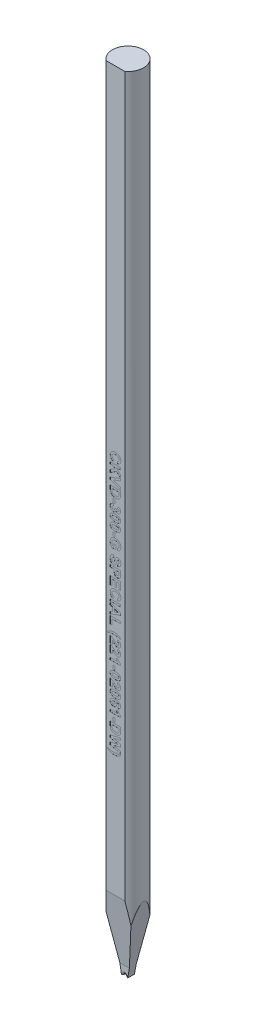
from build123d import *

# Parameters (mm, degrees)
SKETCH_TL_CUTTING_R       = 1.4986
TL_CUTTING_DEPTH          = 75.9968
SKETCH_TDF_GRINDING_W     = 3.0172
SKETCH_TDF_GRINDING_H     = 3.0172
TDF_GRINDING_DEPTH        = 77.026345527
SKETCH_ENGRAVING_W        = 0.166666667
SKETCH_ENGRAVING_H        = 0.371794872
SKETCH_ENGRAVING_W_2      = 1
SKETCH_ENGRAVING_H_2      = 0.192307693
ENGRAVING_DEPTH           = 0.005
VW_VR_GRINDING_DEPTH      = 1.5086
VW_VR_GRINDING_DEPTH_BACK = 1.5086
ISA_GRINDING_DEPTH        = 1.5086
ISA_GRINDING_DEPTH_BACK   = 1.5086
PRE_FRX_BRX_DEPTH         = 1.5086
PRE_FRX_BRX_DEPTH_BACK    = 1.5086
SKETCH_PRE_FRX_BRX_W      = 1.18348
SKETCH_PRE_FRX_BRX_H      = 0.89916
FR_EDM_R                  = 0.14986
BR_EDM_R                  = 0.14986
FA_BA_GRINDING_DEPTH      = 1.5086
FA_BA_GRINDING_DEPTH_BACK = 1.5086


with BuildPart() as part:
    # sketch_TL_cutting → TL_cutting (new body)
    with BuildSketch(Plane(origin=(0, 0, 0), x_dir=(1, 0, 0), z_dir=(0, 1, 0))):
        Circle(SKETCH_TL_CUTTING_R)
    extrude(amount=TL_CUTTING_DEPTH)

    # sketch_TDF_grinding → TDF_grinding (cut, through all)
    with BuildSketch(Plane(origin=(0, 0, 0), x_dir=(1, 0, 0), z_dir=(0, 1, 0))):
        with Locations((0, -2.71002)):
            Rectangle(SKETCH_TDF_GRINDING_W, SKETCH_TDF_GRINDING_H)
    extrude(amount=TDF_GRINDING_DEPTH, mode=Mode.SUBTRACT)

    # sketch_engraving → engraving (cut)
    # profile 1 of 31: a face of its own
    with BuildSketch(Plane.XY.offset(1.20142)):
        with BuildLine():
            Line((-0.128205128, 43.253210256), (-0.192307692, 43.060902564))
            add(Edge.make_bspline(
                [(-0.192307692, 43.060902564), (-0.204917923, 43.064809052), (-0.229612721, 43.072459184), (-0.2649877, 43.086537804), (-0.297871332, 43.102532008), (-0.328259475, 43.120359875), (-0.356049464, 43.140095258), (-0.381471598, 43.161589244), (-0.404368127, 43.185053424), (-0.424673345, 43.210470624), (-0.442633936, 43.237563711), (-0.457816548, 43.266656053), (-0.470893242, 43.29731117), (-0.481488041, 43.329840557), (-0.489972889, 43.364028151), (-0.495577171, 43.400034413), (-0.499377062, 43.437690896), (-0.499789062, 43.463403283), (-0.5, 43.476567628)],
                knots=[0, 0, 0, 0, 1.126670901, 2.206376047, 3.246533763, 4.245677351, 5.210506282, 6.152793389, 7.083980095, 8.004497442, 8.926231833, 9.854395169, 10.801995143, 11.768203916, 12.771938831, 13.805609698, 14.87650608, 16, 16, 16, 16], degree=3))
            add(Edge.make_bspline(
                [(-0.5, 43.476567628), (-0.499663994, 43.492816309), (-0.499003061, 43.524777949), (-0.492350465, 43.571519052), (-0.481969511, 43.616060328), (-0.467601869, 43.658469613), (-0.448555271, 43.698448786), (-0.42571373, 43.736373108), (-0.398318662, 43.771809391), (-0.367249987, 43.804950716), (-0.332452821, 43.835079196), (-0.294134751, 43.861072297), (-0.253074131, 43.883610491), (-0.208709772, 43.901536594), (-0.161353037, 43.915621791), (-0.110975156, 43.925468328), (-0.057578507, 43.931634942), (-0.020984357, 43.932337083), (-0.002203526, 43.932697436)],
                knots=[0, 0, 0, 0, 1.025134988, 2.016471176, 2.973446247, 3.909197306, 4.836872559, 5.763618465, 6.698581235, 7.658772073, 8.627106982, 9.597494692, 10.576422683, 11.578339294, 12.6118974, 13.690673505, 14.814808564, 16, 16, 16, 16], degree=3))
            add(Edge.make_bspline(
                [(-0.002203526, 43.932697436), (0.017576475, 43.9323292), (0.056163648, 43.931610839), (0.112313555, 43.925562878), (0.165084042, 43.915516768), (0.214577853, 43.901940058), (0.260470573, 43.883729249), (0.303160692, 43.861873909), (0.342311169, 43.835756152), (0.377833814, 43.805831091), (0.409480853, 43.772697852), (0.437377469, 43.736993428), (0.460593243, 43.698491041), (0.479896446, 43.657667336), (0.494630503, 43.614223397), (0.505304611, 43.568276602), (0.511505561, 43.519806054), (0.512376199, 43.48666808), (0.512820513, 43.469756731)],
                knots=[0, 0, 0, 0, 1.212773307, 2.365899439, 3.458117515, 4.504331001, 5.50806732, 6.480562534, 7.440239902, 8.387651817, 9.323121479, 10.245404239, 11.160468186, 12.07454208, 13.009500751, 13.96802424, 14.963018902, 16, 16, 16, 16], degree=3))
            add(Edge.make_bspline(
                [(0.512820513, 43.469756731), (0.512448361, 43.454987276), (0.511718707, 43.426029796), (0.506761415, 43.383624506), (0.498061698, 43.343436158), (0.486319015, 43.305247521), (0.470821797, 43.269275987), (0.451884357, 43.235457111), (0.429606892, 43.203674651), (0.412205553, 43.184525065), (0.403445513, 43.174884936)],
                knots=[0, 0, 0, 0, 1.098510076, 2.153775193, 3.169777012, 4.153122333, 5.120892526, 6.076995459, 7.031936742, 8, 8, 8, 8], degree=3))
            add(Edge.make_bspline(
                [(0.403445513, 43.174884936), (0.39787141, 43.169297644), (0.386592274, 43.157991818), (0.367549896, 43.142895368), (0.347050772, 43.128582058), (0.324745215, 43.115279068), (0.30046466, 43.103406849), (0.274581981, 43.092394097), (0.246997406, 43.082255069), (0.227800247, 43.076616604), (0.217948718, 43.073723077)],
                knots=[0, 0, 0, 0, 0.885292881, 1.791380647, 2.722937556, 3.69093542, 4.703306561, 5.754477758, 6.847650944, 8, 8, 8, 8], degree=3))
            Line((0.217948718, 43.073723077), (0.179487179, 43.266030769))
            add(Edge.make_bspline(
                [(0.179487179, 43.266030769), (0.1857949, 43.267665288), (0.198219456, 43.270884861), (0.21607256, 43.27739955), (0.233014714, 43.284871208), (0.248625569, 43.2941361), (0.263619506, 43.303962074), (0.277222328, 43.315624773), (0.290109132, 43.328129754), (0.301694454, 43.342018861), (0.312145605, 43.356893589), (0.321339918, 43.372603983), (0.329014435, 43.389188478), (0.335156827, 43.406521754), (0.340319842, 43.424545702), (0.34350638, 43.443432147), (0.345953545, 43.463015752), (0.3460861, 43.476358875), (0.346153846, 43.483178205)],
                knots=[0, 0, 0, 0, 1.051114734, 2.070420253, 3.064047898, 4.034553068, 4.997066449, 5.953344811, 6.921213386, 7.892675544, 8.867420182, 9.852654213, 10.826683617, 11.811917648, 12.818610352, 13.848120519, 14.900229319, 16, 16, 16, 16], degree=3))
            add(Edge.make_bspline(
                [(0.346153846, 43.483178205), (0.345958725, 43.492542256), (0.345576529, 43.51088423), (0.341532101, 43.53761448), (0.335695112, 43.563055692), (0.326982094, 43.58711706), (0.315677399, 43.609731698), (0.302244603, 43.631228905), (0.286035184, 43.651060806), (0.26758257, 43.669699764), (0.246135655, 43.686407721), (0.221779967, 43.701110652), (0.194212535, 43.713304121), (0.163711493, 43.723204409), (0.130202077, 43.730996736), (0.093641969, 43.736561162), (0.054005962, 43.739638434), (0.026581025, 43.740133903), (0.012419872, 43.740389744)],
                knots=[0, 0, 0, 0, 0.93816214, 1.837638998, 2.704791736, 3.551915875, 4.396257554, 5.235807848, 6.087970119, 6.959042444, 7.860386085, 8.80649345, 9.804409709, 10.875695391, 12.017327537, 13.250155505, 14.580089023, 16, 16, 16, 16], degree=3))
            add(Edge.make_bspline(
                [(0.012419872, 43.740389744), (-0.002609028, 43.740136423), (-0.031567402, 43.739648312), (-0.073337178, 43.736571685), (-0.111754322, 43.730971705), (-0.14688701, 43.723282849), (-0.178713725, 43.713332973), (-0.207179389, 43.701159106), (-0.23231734, 43.686686701), (-0.254110839, 43.669938275), (-0.272831387, 43.651337256), (-0.288926796, 43.631387439), (-0.302688307, 43.610206524), (-0.314010391, 43.587667053), (-0.322575422, 43.563683298), (-0.328786932, 43.538452371), (-0.332735688, 43.511881695), (-0.333131326, 43.493675799), (-0.333333333, 43.484380128)],
                knots=[0, 0, 0, 0, 1.475208372, 2.842499301, 4.107722225, 5.282836115, 6.369007568, 7.375918121, 8.315702116, 9.208439171, 10.065831443, 10.90006451, 11.71996243, 12.54067204, 13.369972975, 14.214060185, 15.088124569, 16, 16, 16, 16], degree=3))
            add(Edge.make_bspline(
                [(-0.333333333, 43.484380128), (-0.333161634, 43.477497953), (-0.332824013, 43.463965176), (-0.330681155, 43.443962689), (-0.326591822, 43.42476438), (-0.321184418, 43.406276281), (-0.314399721, 43.388426559), (-0.305696319, 43.37148748), (-0.295693052, 43.355125777), (-0.283969989, 43.33968094), (-0.270808612, 43.324946156), (-0.255597341, 43.311507159), (-0.238701667, 43.299041373), (-0.220008678, 43.287706947), (-0.199678377, 43.27712516), (-0.177394008, 43.268122121), (-0.153515697, 43.259734984), (-0.136789345, 43.255423153), (-0.128205128, 43.253210256)],
                knots=[0, 0, 0, 0, 0.980177776, 1.927374078, 2.859849964, 3.771585772, 4.668674471, 5.574490016, 6.479656464, 7.396337719, 8.332153134, 9.288470092, 10.28125149, 11.318486971, 12.398724812, 13.541284404, 14.738150009, 16, 16, 16, 16], degree=3))
        make_face()
    # profile 2 of 31: a face of its own
    with BuildSketch(Plane.XY.offset(1.20142)):
        Polygon((-0.5, 42.894235897), (0.5, 42.894235897), (0.5, 42.701928205), (0.052283654, 42.701928205), (0.5, 42.280253526), (0.5, 42.016030769), (0.11338141, 42.395838462), (-0.5, 42.003210256), (-0.5, 42.259420192), (-0.035456731, 42.541671795), (-0.198517628, 42.701928205), (-0.5, 42.701928205), align=None)
    # profile 3 of 31: a face of its own
    with BuildSketch(Plane.XY.offset(1.20142)):
        Polygon((-0.5, 41.627008333), (0.5, 41.9968), (0.5, 41.793675), (-0.243589744, 41.528851282), (0.5, 41.265029167), (0.5, 41.060902564), (-0.5, 41.429291987), align=None)
    # profile 4 of 31: a face of its own
    with BuildSketch(Plane.XY.offset(1.20142)):
        with BuildLine():
            Line((0.5, 40.971158974), (0.5, 40.604372115))
            add(Edge.make_bspline(
                [(0.5, 40.604372115), (0.500005193, 40.594354571), (0.500015306, 40.574848084), (0.498840892, 40.546539066), (0.497659587, 40.520066494), (0.495294873, 40.495506352), (0.492816233, 40.472773432), (0.489678088, 40.451826942), (0.485656212, 40.432799202), (0.482484481, 40.420800319), (0.480969551, 40.415069231)],
                knots=[0, 0, 0, 0, 1.259756885, 2.453039283, 3.563158368, 4.591894114, 5.55549294, 6.43918076, 7.254497783, 8, 8, 8, 8], degree=3))
            add(Edge.make_bspline(
                [(0.480969551, 40.415069231), (0.478637325, 40.407900254), (0.474014881, 40.393691431), (0.465827813, 40.372838378), (0.455960096, 40.353004479), (0.445111978, 40.333729819), (0.432903728, 40.315457553), (0.419595761, 40.297742873), (0.404753223, 40.281109803), (0.383633179, 40.25957514), (0.35420815, 40.235150255), (0.315375005, 40.20931972), (0.272594656, 40.187582014), (0.234409605, 40.172390641), (0.20183843, 40.162346542), (0.175754603, 40.155778141), (0.148301213, 40.150106468), (0.119383738, 40.145856292), (0.08913491, 40.142194906), (0.057465542, 40.139567238), (0.024383276, 40.13826625), (0.001870575, 40.137974494), (-0.009615385, 40.137825641)],
                knots=[0, 0, 0, 0, 0.745431882, 1.477436776, 2.212739876, 2.934276521, 3.663147754, 4.384200836, 5.123377481, 5.865761747, 7.365547505, 8.894711587, 10.468722596, 12.101948761, 12.951987285, 13.837595333, 14.760899389, 15.722756883, 16.726861385, 17.773652936, 18.864119771, 20, 20, 20, 20], degree=3))
            add(Edge.make_bspline(
                [(-0.009615385, 40.137825641), (-0.0294616, 40.138217046), (-0.067834928, 40.13897384), (-0.123301552, 40.144571211), (-0.17465514, 40.153866648), (-0.206804138, 40.163577075), (-0.222355769, 40.168274359)],
                knots=[0, 0, 0, 0, 1.103491527, 2.133638164, 3.0971734, 4, 4, 4, 4], degree=3))
            add(Edge.make_bspline(
                [(-0.222355769, 40.168274359), (-0.231274521, 40.171448003), (-0.248819098, 40.177691057), (-0.274127236, 40.188615932), (-0.298211673, 40.200420337), (-0.321053432, 40.213202184), (-0.342549771, 40.227026052), (-0.362636394, 40.241943645), (-0.381577746, 40.257723731), (-0.393236239, 40.26915549), (-0.399038462, 40.274844872)],
                knots=[0, 0, 0, 0, 1.090884612, 2.145940218, 3.175104604, 4.181306866, 5.161203701, 6.118658341, 7.063689906, 8, 8, 8, 8], degree=3))
            add(Edge.make_bspline(
                [(-0.399038462, 40.274844872), (-0.407300305, 40.284131145), (-0.424264154, 40.303198431), (-0.445652736, 40.33654995), (-0.464086504, 40.374425276), (-0.473760833, 40.401739168), (-0.478766026, 40.415870513)],
                knots=[0, 0, 0, 0, 0.912008655, 1.872605891, 2.89935344, 4, 4, 4, 4], degree=3))
            add(Edge.make_bspline(
                [(-0.478766026, 40.415870513), (-0.4805228, 40.421590486), (-0.484168894, 40.433461996), (-0.488062998, 40.452285444), (-0.492165475, 40.472379947), (-0.49463687, 40.493977223), (-0.497243066, 40.516853081), (-0.498706299, 40.541189822), (-0.49974511, 40.566903081), (-0.499913777, 40.584539175), (-0.5, 40.593554808)],
                knots=[0, 0, 0, 0, 0.799129865, 1.658552685, 2.566799617, 3.538529252, 4.561352959, 5.643373779, 6.795284424, 8, 8, 8, 8], degree=3))
            Line((-0.5, 40.593554808), (-0.5, 40.971158974))
            Line((-0.5, 40.971158974), (0.5, 40.971158974))
        make_face()
        with BuildLine():
            Line((0.333333333, 40.778851282), (-0.333333333, 40.778851282))
            Line((-0.333333333, 40.778851282), (-0.333333333, 40.620598077))
            add(Edge.make_bspline(
                [(-0.333333333, 40.620598077), (-0.333276671, 40.61345336), (-0.333167574, 40.599697049), (-0.332847006, 40.579791316), (-0.331979167, 40.561498115), (-0.331080228, 40.544721614), (-0.329595022, 40.52950549), (-0.328134266, 40.515783535), (-0.326090699, 40.503632132), (-0.324477534, 40.496127127), (-0.323717949, 40.492593269)],
                knots=[0, 0, 0, 0, 1.333384787, 2.567275092, 3.714769766, 4.750907381, 5.701951617, 6.567520054, 7.325492842, 8, 8, 8, 8], degree=3))
            add(Edge.make_bspline(
                [(-0.323717949, 40.492593269), (-0.321509316, 40.484316575), (-0.317207482, 40.468195757), (-0.307617456, 40.445560499), (-0.296048139, 40.425078507), (-0.282136533, 40.40640677), (-0.26455548, 40.38957967), (-0.242070693, 40.375215683), (-0.215254411, 40.361922192), (-0.189584523, 40.352818806), (-0.16665678, 40.346284413), (-0.147412959, 40.341861165), (-0.126593091, 40.338365591), (-0.104279343, 40.335358942), (-0.080500412, 40.332929499), (-0.055170426, 40.331417784), (-0.028320392, 40.330386029), (-0.009883527, 40.330219161), (-0.000400641, 40.330133333)],
                knots=[0, 0, 0, 0, 1.038686998, 2.023088296, 2.974059649, 3.888265163, 4.839857954, 5.909819677, 7.113156087, 8.466843969, 9.20827164, 10.006482943, 10.861893492, 11.769681931, 12.739021491, 13.762258324, 14.849031541, 16, 16, 16, 16], degree=3))
            add(Edge.make_bspline(
                [(-0.000400641, 40.330133333), (0.009082275, 40.3302185), (0.027452469, 40.330383485), (0.054102292, 40.331413664), (0.079033415, 40.332916863), (0.102276578, 40.335363691), (0.123864169, 40.338323456), (0.143813574, 40.341860891), (0.161996804, 40.346254423), (0.183589283, 40.352807511), (0.207947697, 40.362644996), (0.23429421, 40.376471199), (0.2571147, 40.392736402), (0.276689574, 40.411091558), (0.29287817, 40.432178569), (0.306422028, 40.455549371), (0.316938162, 40.481680279), (0.321416742, 40.500269318), (0.323717949, 40.509820833)],
                knots=[0, 0, 0, 0, 1.118059345, 2.165891593, 3.144157881, 4.062285166, 4.920717571, 5.712910489, 6.449981617, 7.12489426, 8.371943983, 9.541298068, 10.624898781, 11.666293176, 12.69306237, 13.747704633, 14.842713931, 16, 16, 16, 16], degree=3))
            add(Edge.make_bspline(
                [(0.323717949, 40.509820833), (0.324486218, 40.513955143), (0.326177652, 40.523057311), (0.328151987, 40.538161571), (0.329628909, 40.555948179), (0.331099472, 40.576377116), (0.331977905, 40.599427064), (0.332859431, 40.625132571), (0.333166326, 40.653516851), (0.333276065, 40.673349207), (0.333333333, 40.683699038)],
                knots=[0, 0, 0, 0, 0.578739524, 1.274162912, 2.095457587, 3.035141998, 4.093102578, 5.270121571, 6.575369351, 8, 8, 8, 8], degree=3))
            Line((0.333333333, 40.683699038), (0.333333333, 40.778851282))
        make_face(mode=Mode.SUBTRACT)
    # profile 5 of 31: a face of its own
    with BuildSketch(Plane.XY.offset(1.20142)):
        with Locations((-0.147435898, 39.810902564)):
            Rectangle(SKETCH_ENGRAVING_W, SKETCH_ENGRAVING_H)
    # profile 6 of 31: a face of its own
    with BuildSketch(Plane.XY.offset(1.20142)):
        with BuildLine():
            Line((-0.215945513, 39.560902564), (-0.192307692, 39.368594872))
            add(Edge.make_bspline(
                [(-0.192307692, 39.368594872), (-0.204132194, 39.366934047), (-0.226576764, 39.363781568), (-0.25764429, 39.353952911), (-0.284674848, 39.341119233), (-0.306838708, 39.324137778), (-0.324372016, 39.30451589), (-0.33711688, 39.28269994), (-0.34490548, 39.258667347), (-0.345732378, 39.241916439), (-0.346153846, 39.233378526)],
                knots=[0, 0, 0, 0, 1.266221457, 2.403466716, 3.446976871, 4.428566981, 5.347951143, 6.225000641, 7.095285456, 8, 8, 8, 8], degree=3))
            add(Edge.make_bspline(
                [(-0.346153846, 39.233378526), (-0.346055611, 39.228763461), (-0.345861023, 39.219621738), (-0.343788926, 39.206189506), (-0.340465357, 39.193318943), (-0.335437029, 39.181131108), (-0.329556159, 39.169386661), (-0.32227181, 39.158136899), (-0.313281658, 39.147822443), (-0.303428531, 39.137759798), (-0.292217285, 39.128828114), (-0.280052259, 39.120960902), (-0.267055651, 39.114054907), (-0.252891939, 39.108702089), (-0.237868043, 39.104512024), (-0.221918716, 39.101516531), (-0.205104086, 39.099693476), (-0.193581061, 39.099475398), (-0.187700321, 39.099364103)],
                knots=[0, 0, 0, 0, 0.951793398, 1.885354025, 2.797928458, 3.688489604, 4.600647717, 5.506538063, 6.445271935, 7.419741996, 8.409776722, 9.395967385, 10.406883209, 11.440832221, 12.514165763, 13.622322902, 14.786559767, 16, 16, 16, 16], degree=3))
            add(Edge.make_bspline(
                [(-0.187700321, 39.099364103), (-0.176786947, 39.099782422), (-0.155968497, 39.100580413), (-0.126418152, 39.106706809), (-0.100528778, 39.117413017), (-0.078485293, 39.132091647), (-0.060832569, 39.149880913), (-0.047691388, 39.169890944), (-0.040013472, 39.192114606), (-0.038982665, 39.207547528), (-0.038461538, 39.215349679)],
                knots=[0, 0, 0, 0, 1.241181749, 2.367689556, 3.413199457, 4.409869786, 5.360751057, 6.245864667, 7.113192516, 8, 8, 8, 8], degree=3))
            add(Edge.make_bspline(
                [(-0.038461538, 39.215349679), (-0.038603641, 39.220903112), (-0.038904883, 39.232675803), (-0.04203482, 39.250987586), (-0.046354275, 39.270956665), (-0.050509304, 39.28455409), (-0.052684295, 39.291671795)],
                knots=[0, 0, 0, 0, 0.854525515, 1.811503923, 2.854410343, 4, 4, 4, 4], degree=3))
            Line((-0.052684295, 39.291671795), (0.102564103, 39.273642949))
            add(Edge.make_bspline(
                [(0.102564103, 39.273642949), (0.102472429, 39.268298846), (0.102294537, 39.257928639), (0.103550083, 39.242785032), (0.10584242, 39.22861013), (0.10956176, 39.215437094), (0.114073964, 39.203253353), (0.119743619, 39.19195343), (0.126797738, 39.181809885), (0.137452935, 39.169474156), (0.153346669, 39.156772172), (0.175381237, 39.145719273), (0.200195104, 39.138963806), (0.217704887, 39.138213684), (0.226762821, 39.137825641)],
                knots=[0, 0, 0, 0, 0.916921599, 1.779281976, 2.604591006, 3.377627834, 4.124827521, 4.832199257, 5.541147775, 6.239830602, 7.625300353, 8.999010263, 10.447566839, 12, 12, 12, 12], degree=3))
            add(Edge.make_bspline(
                [(0.226762821, 39.137825641), (0.234476764, 39.138076334), (0.249283176, 39.138557523), (0.270180788, 39.143795916), (0.288882255, 39.151670608), (0.304586758, 39.163298575), (0.317487731, 39.177454609), (0.326781862, 39.194094939), (0.332438867, 39.212988834), (0.333026806, 39.226259453), (0.333333333, 39.233178205)],
                knots=[0, 0, 0, 0, 1.147344735, 2.202253707, 3.191599761, 4.153119954, 5.090433954, 6.026214277, 6.97094964, 8, 8, 8, 8], degree=3))
            add(Edge.make_bspline(
                [(0.333333333, 39.233178205), (0.332987648, 39.240108214), (0.332308151, 39.253730209), (0.325708071, 39.273198134), (0.315274673, 39.291041507), (0.300599014, 39.306910612), (0.282168696, 39.320609405), (0.259890756, 39.331566627), (0.233746812, 39.338998565), (0.214986903, 39.341591309), (0.205128205, 39.342953846)],
                knots=[0, 0, 0, 0, 0.89036141, 1.750142028, 2.61780756, 3.537452052, 4.514848764, 5.561443886, 6.71849122, 8, 8, 8, 8], degree=3))
            Line((0.205128205, 39.342953846), (0.233974359, 39.535261538))
            add(Edge.make_bspline(
                [(0.233974359, 39.535261538), (0.248657574, 39.532092323), (0.276764536, 39.526025734), (0.316129698, 39.513601503), (0.350961973, 39.499111687), (0.381387831, 39.481841655), (0.408215463, 39.461735814), (0.431647434, 39.43801335), (0.452006068, 39.41068244), (0.469141566, 39.380007941), (0.48286138, 39.346638807), (0.493019554, 39.311130657), (0.49884023, 39.273568376), (0.49960808, 39.247888246), (0.5, 39.234780769)],
                knots=[0, 0, 0, 0, 1.22092895, 2.337131514, 3.351677773, 4.283094182, 5.174661873, 6.069250129, 6.984703325, 7.937694494, 8.918809374, 9.912257166, 10.934388599, 12, 12, 12, 12], degree=3))
            add(Edge.make_bspline(
                [(0.5, 39.234780769), (0.499743324, 39.2236156), (0.499240363, 39.201737211), (0.494922998, 39.169742302), (0.487994845, 39.139386892), (0.478138042, 39.110772682), (0.465473847, 39.083830657), (0.449646388, 39.058807035), (0.431514029, 39.03506228), (0.417247021, 39.021076666), (0.41005609, 39.014027564)],
                knots=[0, 0, 0, 0, 1.090586174, 2.137027055, 3.148380755, 4.128502444, 5.088724121, 6.050075692, 7.017189, 8, 8, 8, 8], degree=3))
            add(Edge.make_bspline(
                [(0.41005609, 39.014027564), (0.403937931, 39.008574347), (0.391853934, 38.997803677), (0.372464834, 38.983852563), (0.352400741, 38.972065213), (0.33177098, 38.962511955), (0.310637907, 38.954751566), (0.288816497, 38.949344728), (0.26639464, 38.946049626), (0.251213033, 38.945695679), (0.243589744, 38.945517949)],
                knots=[0, 0, 0, 0, 1.065686435, 2.104841259, 3.101590809, 4.088754543, 5.058798532, 6.025881737, 7.008716709, 8, 8, 8, 8], degree=3))
            add(Edge.make_bspline(
                [(0.243589744, 38.945517949), (0.232867144, 38.945908156), (0.211730927, 38.946677325), (0.180999661, 38.95378324), (0.151856431, 38.9651029), (0.124562561, 38.981157174), (0.09868881, 39.001390588), (0.075169415, 39.026716452), (0.052695262, 39.055962269), (0.04001359, 39.077965891), (0.033453526, 39.089348077)],
                knots=[0, 0, 0, 0, 0.957658001, 1.887720032, 2.804751961, 3.743912922, 4.709136476, 5.731252806, 6.826406682, 8, 8, 8, 8], degree=3))
            add(Edge.make_bspline(
                [(0.033453526, 39.089348077), (0.031822372, 39.082575609), (0.028603533, 39.069211152), (0.022022537, 39.049914744), (0.01367829, 39.031857672), (0.004232675, 39.014675623), (-0.006542103, 38.998465765), (-0.018789165, 38.983273779), (-0.032819972, 38.969556037), (-0.047679673, 38.956452996), (-0.063887586, 38.944903284), (-0.081022983, 38.934871663), (-0.098866636, 38.926186197), (-0.117582182, 38.919174095), (-0.137087229, 38.913733972), (-0.157475267, 38.910006248), (-0.178623511, 38.907493745), (-0.193034825, 38.907203264), (-0.200320513, 38.90705641)],
                knots=[0, 0, 0, 0, 1.03751577, 2.047382676, 3.031239205, 3.997486026, 4.965932412, 5.927662117, 6.898405035, 7.88572577, 8.876798211, 9.857834218, 10.841137353, 11.829660183, 12.831310853, 13.853692922, 14.91492721, 16, 16, 16, 16], degree=3))
            add(Edge.make_bspline(
                [(-0.200320513, 38.90705641), (-0.2109584, 38.907272661), (-0.231937745, 38.907699137), (-0.2626715, 38.912674881), (-0.292387684, 38.919627328), (-0.320688592, 38.930285264), (-0.348018602, 38.943444593), (-0.373770643, 38.960112865), (-0.398719241, 38.979175045), (-0.421838487, 39.001351285), (-0.443209677, 39.02548231), (-0.461662849, 39.051583574), (-0.477734226, 39.078862651), (-0.490419897, 39.107847217), (-0.500667813, 39.138101873), (-0.507459472, 39.169976996), (-0.512114414, 39.203193455), (-0.512582989, 39.225883302), (-0.512820513, 39.237384936)],
                knots=[0, 0, 0, 0, 1.00633359, 1.984625146, 2.941575753, 3.891818189, 4.841976474, 5.80848851, 6.791183869, 7.810935832, 8.837000052, 9.838854168, 10.83333837, 11.829730352, 12.829487178, 13.852742075, 14.911540725, 16, 16, 16, 16], degree=3))
            add(Edge.make_bspline(
                [(-0.512820513, 39.237384936), (-0.512637793, 39.248283744), (-0.51227889, 39.26969157), (-0.508027091, 39.301030842), (-0.501772194, 39.331046869), (-0.492621954, 39.35956445), (-0.481351422, 39.386831997), (-0.466822586, 39.412334845), (-0.450309361, 39.436729476), (-0.430965435, 39.459218893), (-0.409882535, 39.480129186), (-0.386697234, 39.498496375), (-0.362149526, 39.514863988), (-0.336021778, 39.528941702), (-0.308246096, 39.540611545), (-0.278894175, 39.549698132), (-0.248055897, 39.55694486), (-0.226796469, 39.55956515), (-0.215945513, 39.560902564)],
                knots=[0, 0, 0, 0, 1.077528213, 2.11651914, 3.123276654, 4.10732375, 5.075386463, 6.036572488, 7.005896639, 7.98540975, 8.966414275, 9.939311093, 10.906719916, 11.882103104, 12.870994428, 13.882228509, 14.919075059, 16, 16, 16, 16], degree=3))
        make_face()
    # profile 7 of 31: a face of its own
    with BuildSketch(Plane.XY.offset(1.20142)):
        with BuildLine():
            add(Edge.make_bspline(
                [(0.5, 38.464748718), (0.49971384, 38.452844998), (0.499156721, 38.429669821), (0.494192381, 38.395907508), (0.486315205, 38.364154925), (0.474936732, 38.334405943), (0.460535804, 38.306509267), (0.442472771, 38.280857415), (0.421624591, 38.25685643), (0.405435577, 38.243000797), (0.397235577, 38.235982692)],
                knots=[0, 0, 0, 0, 1.098626248, 2.138899374, 3.143835643, 4.113754749, 5.073488057, 6.034745239, 7.004566348, 8, 8, 8, 8], degree=3))
            add(Edge.make_bspline(
                [(0.397235577, 38.235982692), (0.392013767, 38.231967993), (0.381356969, 38.223774695), (0.364136726, 38.21274029), (0.345869985, 38.202131685), (0.326116385, 38.192873442), (0.305221356, 38.184000078), (0.283126793, 38.175809313), (0.259707844, 38.16857695), (0.235071142, 38.162272124), (0.209179241, 38.156378627), (0.181968999, 38.151441398), (0.15350924, 38.147215972), (0.123831018, 38.143920738), (0.092992495, 38.140966339), (0.060842825, 38.139349757), (0.027454838, 38.138025267), (0.004742429, 38.137892949), (-0.006810897, 38.137825641)],
                knots=[0, 0, 0, 0, 0.746775751, 1.524038446, 2.317840886, 3.141016509, 3.996283186, 4.892488336, 5.812382473, 6.774967264, 7.776368117, 8.823659909, 9.910833035, 11.039122168, 12.210293276, 13.424012874, 14.68964937, 16, 16, 16, 16], degree=3))
            add(Edge.make_bspline(
                [(-0.006810897, 38.137825641), (-0.01836425, 38.137891934), (-0.041009977, 38.138021876), (-0.074330982, 38.139354693), (-0.106413621, 38.140967781), (-0.13725379, 38.143913853), (-0.166926114, 38.147240728), (-0.195353975, 38.151346272), (-0.22243919, 38.156664764), (-0.248289812, 38.162471418), (-0.27303117, 38.168736077), (-0.296407841, 38.1762899), (-0.318777777, 38.184150303), (-0.339699687, 38.193229898), (-0.359477735, 38.202820372), (-0.377930928, 38.213271112), (-0.395257891, 38.224428726), (-0.40597091, 38.232701289), (-0.411258013, 38.236783974)],
                knots=[0, 0, 0, 0, 1.308411734, 2.564617834, 3.776541518, 4.94597967, 6.0725993, 7.15816376, 8.197872509, 9.197791611, 10.158952087, 11.086962723, 11.979249638, 12.843171697, 13.668427753, 14.467630577, 15.243743175, 16, 16, 16, 16], degree=3))
            add(Edge.make_bspline(
                [(-0.411258013, 38.236783974), (-0.419387722, 38.243737875), (-0.435436162, 38.257465209), (-0.456111536, 38.281200465), (-0.473801555, 38.3068109), (-0.487914093, 38.334657064), (-0.499368982, 38.364261236), (-0.506993451, 38.396065546), (-0.511967929, 38.429735616), (-0.512532265, 38.452911213), (-0.512820513, 38.464748718)],
                knots=[0, 0, 0, 0, 0.991667276, 1.957599061, 2.911530233, 3.873218945, 4.847995157, 5.850445929, 6.902062539, 8, 8, 8, 8], degree=3))
            add(Edge.make_bspline(
                [(-0.512820513, 38.464748718), (-0.512476011, 38.476721133), (-0.511800941, 38.500181702), (-0.506449472, 38.534435149), (-0.497876451, 38.566994622), (-0.485636462, 38.597743234), (-0.469774335, 38.626636989), (-0.45076002, 38.653901616), (-0.427732542, 38.678943948), (-0.40629523, 38.698549361), (-0.386925042, 38.712892741), (-0.37086259, 38.723009036), (-0.353675124, 38.732785358), (-0.33482528, 38.741223499), (-0.314870578, 38.749548475), (-0.293380967, 38.756921787), (-0.270541238, 38.763426959), (-0.246455682, 38.769534901), (-0.220958398, 38.774628025), (-0.194124629, 38.779312952), (-0.165840258, 38.783004927), (-0.136262825, 38.786278243), (-0.105322509, 38.788582844), (-0.073069943, 38.790454475), (-0.039401887, 38.791392969), (-0.01649349, 38.791577608), (-0.004807692, 38.791671795)],
                knots=[0, 0, 0, 0, 1.257818097, 2.464759732, 3.634271214, 4.790227596, 5.933394726, 7.09190477, 8.274482889, 9.50191983, 10.139172818, 10.805000628, 11.49619854, 12.215266328, 12.973768034, 13.768328009, 14.601232062, 15.469317089, 16.379095881, 17.333267023, 18.331755967, 19.376479622, 20.460535752, 21.592206075, 22.771760786, 24, 24, 24, 24], degree=3))
            add(Edge.make_bspline(
                [(-0.004807692, 38.791671795), (0.006678925, 38.791606), (0.02919122, 38.791477052), (0.062378132, 38.790134948), (0.094328674, 38.788541634), (0.12509981, 38.78556902), (0.154640959, 38.782269515), (0.183004063, 38.778156894), (0.209982531, 38.772738814), (0.235876189, 38.767389743), (0.260431507, 38.760649782), (0.2837906, 38.753224475), (0.306110518, 38.745390136), (0.326924245, 38.736217854), (0.346659803, 38.726682898), (0.365109758, 38.716224838), (0.382437536, 38.705069066), (0.39315045, 38.696796265), (0.3984375, 38.692713462)],
                knots=[0, 0, 0, 0, 1.304443357, 2.556541329, 3.771813033, 4.936929721, 6.066661712, 7.147723817, 8.190304831, 9.191350322, 10.149780912, 11.080355239, 11.975107155, 12.834450748, 13.66198663, 14.463397305, 15.241653965, 16, 16, 16, 16], degree=3))
            add(Edge.make_bspline(
                [(0.3984375, 38.692713462), (0.406566428, 38.685759179), (0.422613323, 38.672031089), (0.443299998, 38.648301361), (0.460913987, 38.622719209), (0.475197493, 38.594954301), (0.486497465, 38.565282107), (0.494183265, 38.533436121), (0.499144648, 38.499760686), (0.499710816, 38.476585839), (0.5, 38.464748718)],
                knots=[0, 0, 0, 0, 0.991631672, 1.957528776, 2.911425699, 3.867574088, 4.848108326, 5.850523106, 6.902101959, 8, 8, 8, 8], degree=3))
        make_face()
        with BuildLine():
            add(Edge.make_bspline(
                [(0.333333333, 38.464748718), (0.333068079, 38.470916684), (0.332548986, 38.482987158), (0.328316127, 38.500542094), (0.321759633, 38.517123165), (0.312130705, 38.532681206), (0.299093083, 38.54708978), (0.281476094, 38.559297658), (0.259881539, 38.569851162), (0.243736, 38.575130771), (0.235176282, 38.577929808)],
                knots=[0, 0, 0, 0, 0.909107913, 1.77908945, 2.650019014, 3.530482969, 4.465025013, 5.495890128, 6.672421267, 8, 8, 8, 8], degree=3))
            add(Edge.make_bspline(
                [(0.235176282, 38.577929808), (0.228718042, 38.579677997), (0.214837576, 38.583435317), (0.192206647, 38.58769972), (0.166522939, 38.591216485), (0.137792419, 38.594186038), (0.105999886, 38.596602628), (0.071125109, 38.598090848), (0.033192525, 38.599119478), (0.006878451, 38.599280391), (-0.006810897, 38.599364103)],
                knots=[0, 0, 0, 0, 0.658986521, 1.416336438, 2.266694271, 3.212608458, 4.261595115, 5.407496572, 6.651304179, 8, 8, 8, 8], degree=3))
            add(Edge.make_bspline(
                [(-0.006810897, 38.599364103), (-0.020433943, 38.599373117), (-0.046549094, 38.599390397), (-0.084006477, 38.598216163), (-0.118154033, 38.59704872), (-0.148991056, 38.594679061), (-0.176626244, 38.592340892), (-0.200847568, 38.588803343), (-0.221857789, 38.585250608), (-0.244486895, 38.579217153), (-0.268257705, 38.570901394), (-0.292448985, 38.559672977), (-0.311537375, 38.547007058), (-0.325415776, 38.532475587), (-0.334597404, 38.516730329), (-0.341538269, 38.500426395), (-0.345246665, 38.482874555), (-0.345848983, 38.470840013), (-0.346153846, 38.464748718)],
                knots=[0, 0, 0, 0, 1.613038927, 3.092168624, 4.43749063, 5.658264602, 6.75425577, 7.720394221, 8.556328411, 9.275513998, 10.490872946, 11.534172084, 12.42681833, 13.187531851, 13.88996177, 14.574222125, 15.278341114, 16, 16, 16, 16], degree=3))
            add(Edge.make_bspline(
                [(-0.346153846, 38.464748718), (-0.345874419, 38.45865088), (-0.345321688, 38.446588799), (-0.341225408, 38.429056833), (-0.334465655, 38.412499336), (-0.325029126, 38.396836493), (-0.311901617, 38.38241441), (-0.294300445, 38.370197614), (-0.272700888, 38.35964693), (-0.25655611, 38.354366893), (-0.247996795, 38.351567628)],
                knots=[0, 0, 0, 0, 0.899391665, 1.779078861, 2.640979247, 3.529945348, 4.464599804, 5.495588918, 6.672261578, 8, 8, 8, 8], degree=3))
            add(Edge.make_bspline(
                [(-0.247996795, 38.351567628), (-0.241538043, 38.349821968), (-0.227719754, 38.346087186), (-0.205229709, 38.341792396), (-0.179679092, 38.33826611), (-0.151079269, 38.335324791), (-0.11935541, 38.332884431), (-0.084546407, 38.331408845), (-0.046680798, 38.330379247), (-0.020433482, 38.330217356), (-0.006810897, 38.330133333)],
                knots=[0, 0, 0, 0, 0.66114423, 1.414496391, 2.261103113, 3.210114492, 4.255954433, 5.405607896, 6.653488082, 8, 8, 8, 8], degree=3))
            add(Edge.make_bspline(
                [(-0.006810897, 38.330133333), (0.006810741, 38.330247109), (0.032921137, 38.330465199), (0.070464093, 38.331092091), (0.104645163, 38.332847006), (0.13553417, 38.334603226), (0.163028833, 38.337568631), (0.187277888, 38.340511537), (0.208178651, 38.344583667), (0.23096624, 38.350175697), (0.254848985, 38.35851368), (0.278913284, 38.37008584), (0.298191428, 38.38252291), (0.312146257, 38.397029879), (0.321683592, 38.412748044), (0.328364426, 38.429200374), (0.332523972, 38.446649531), (0.333060584, 38.45864941), (0.333333333, 38.464748718)],
                knots=[0, 0, 0, 0, 1.611458614, 3.088895909, 4.441089836, 5.660086535, 6.747875232, 7.711965119, 8.548505902, 9.26500436, 10.486583113, 11.532259092, 12.419544583, 13.184925779, 13.890764661, 14.581638641, 15.279074115, 16, 16, 16, 16], degree=3))
        make_face(mode=Mode.SUBTRACT)
    # profile 8 of 31: a face of its own
    with BuildSketch(Plane.XY.offset(1.20142)):
        with BuildLine():
            add(Edge.make_bspline(
                [(0.5, 37.695517949), (0.49971384, 37.683614229), (0.499156721, 37.660439051), (0.494192381, 37.626676739), (0.486315205, 37.594924156), (0.474936732, 37.565175173), (0.460535804, 37.537278497), (0.442472771, 37.511626646), (0.421624591, 37.487625661), (0.405435577, 37.473770028), (0.397235577, 37.466751923)],
                knots=[0, 0, 0, 0, 1.098626248, 2.138899374, 3.143835643, 4.113754749, 5.073488057, 6.034745239, 7.004566348, 8, 8, 8, 8], degree=3))
            add(Edge.make_bspline(
                [(0.397235577, 37.466751923), (0.392013767, 37.462737224), (0.381356969, 37.454543926), (0.364136726, 37.44350952), (0.345869985, 37.432900915), (0.326116385, 37.423642673), (0.305221356, 37.414769309), (0.283126793, 37.406578544), (0.259707844, 37.39934618), (0.235071142, 37.393041354), (0.209179241, 37.387147858), (0.181968999, 37.382210628), (0.15350924, 37.377985203), (0.123831018, 37.374689969), (0.092992495, 37.37173557), (0.060842825, 37.370118988), (0.027454838, 37.368794498), (0.004742429, 37.368662179), (-0.006810897, 37.368594872)],
                knots=[0, 0, 0, 0, 0.746775751, 1.524038446, 2.317840886, 3.141016509, 3.996283186, 4.892488336, 5.812382473, 6.774967264, 7.776368117, 8.823659909, 9.910833035, 11.039122168, 12.210293276, 13.424012874, 14.68964937, 16, 16, 16, 16], degree=3))
            add(Edge.make_bspline(
                [(-0.006810897, 37.368594872), (-0.01836425, 37.368661165), (-0.041009977, 37.368791107), (-0.074330982, 37.370123924), (-0.106413621, 37.371737012), (-0.13725379, 37.374683084), (-0.166926114, 37.378009959), (-0.195353975, 37.382115503), (-0.22243919, 37.387433995), (-0.248289812, 37.393240649), (-0.27303117, 37.399505308), (-0.296407841, 37.407059131), (-0.318777777, 37.414919533), (-0.339699687, 37.423999129), (-0.359477735, 37.433589602), (-0.377930928, 37.444040342), (-0.395257891, 37.455197957), (-0.40597091, 37.46347052), (-0.411258013, 37.467553205)],
                knots=[0, 0, 0, 0, 1.308411734, 2.564617834, 3.776541518, 4.94597967, 6.0725993, 7.15816376, 8.197872509, 9.197791611, 10.158952087, 11.086962723, 11.979249638, 12.843171697, 13.668427753, 14.467630577, 15.243743175, 16, 16, 16, 16], degree=3))
            add(Edge.make_bspline(
                [(-0.411258013, 37.467553205), (-0.419387722, 37.474507105), (-0.435436162, 37.48823444), (-0.456111536, 37.511969695), (-0.473801555, 37.537580131), (-0.487914093, 37.565426295), (-0.499368982, 37.595030467), (-0.506993451, 37.626834777), (-0.511967929, 37.660504847), (-0.512532265, 37.683680444), (-0.512820513, 37.695517949)],
                knots=[0, 0, 0, 0, 0.991667276, 1.957599061, 2.911530233, 3.873218945, 4.847995157, 5.850445929, 6.902062539, 8, 8, 8, 8], degree=3))
            add(Edge.make_bspline(
                [(-0.512820513, 37.695517949), (-0.512476011, 37.707490364), (-0.511800941, 37.730950933), (-0.506449472, 37.765204379), (-0.497876451, 37.797763853), (-0.485636462, 37.828512465), (-0.469774335, 37.85740622), (-0.45076002, 37.884670847), (-0.427732542, 37.909713179), (-0.40629523, 37.929318592), (-0.386925042, 37.943661971), (-0.37086259, 37.953778267), (-0.353675124, 37.963554589), (-0.33482528, 37.97199273), (-0.314870578, 37.980317706), (-0.293380967, 37.987691018), (-0.270541238, 37.99419619), (-0.246455682, 38.000304132), (-0.220958398, 38.005397256), (-0.194124629, 38.010082183), (-0.165840258, 38.013774157), (-0.136262825, 38.017047473), (-0.105322509, 38.019352075), (-0.073069943, 38.021223706), (-0.039401887, 38.0221622), (-0.01649349, 38.022346839), (-0.004807692, 38.022441026)],
                knots=[0, 0, 0, 0, 1.257818097, 2.464759732, 3.634271214, 4.790227596, 5.933394726, 7.09190477, 8.274482889, 9.50191983, 10.139172818, 10.805000628, 11.49619854, 12.215266328, 12.973768034, 13.768328009, 14.601232062, 15.469317089, 16.379095881, 17.333267023, 18.331755967, 19.376479622, 20.460535752, 21.592206075, 22.771760786, 24, 24, 24, 24], degree=3))
            add(Edge.make_bspline(
                [(-0.004807692, 38.022441026), (0.006678925, 38.022375231), (0.02919122, 38.022246282), (0.062378132, 38.020904179), (0.094328674, 38.019310865), (0.12509981, 38.016338251), (0.154640959, 38.013038746), (0.183004063, 38.008926125), (0.209982531, 38.003508045), (0.235876189, 37.998158974), (0.260431507, 37.991419013), (0.2837906, 37.983993706), (0.306110518, 37.976159367), (0.326924245, 37.966987084), (0.346659803, 37.957452128), (0.365109758, 37.946994069), (0.382437536, 37.935838297), (0.39315045, 37.927565495), (0.3984375, 37.923482692)],
                knots=[0, 0, 0, 0, 1.304443357, 2.556541329, 3.771813033, 4.936929721, 6.066661712, 7.147723817, 8.190304831, 9.191350322, 10.149780912, 11.080355239, 11.975107155, 12.834450748, 13.66198663, 14.463397305, 15.241653965, 16, 16, 16, 16], degree=3))
            add(Edge.make_bspline(
                [(0.3984375, 37.923482692), (0.406566428, 37.91652841), (0.422613323, 37.90280032), (0.443299998, 37.879070592), (0.460913987, 37.853488439), (0.475197493, 37.825723532), (0.486497465, 37.796051338), (0.494183265, 37.764205352), (0.499144648, 37.730529916), (0.499710816, 37.70735507), (0.5, 37.695517949)],
                knots=[0, 0, 0, 0, 0.991631672, 1.957528776, 2.911425699, 3.867574088, 4.848108326, 5.850523106, 6.902101959, 8, 8, 8, 8], degree=3))
        make_face()
        with BuildLine():
            add(Edge.make_bspline(
                [(0.333333333, 37.695517949), (0.333068079, 37.701685915), (0.332548986, 37.713756389), (0.328316127, 37.731311325), (0.321759633, 37.747892396), (0.312130705, 37.763450436), (0.299093083, 37.777859011), (0.281476094, 37.790066888), (0.259881539, 37.800620392), (0.243736, 37.805900001), (0.235176282, 37.808699038)],
                knots=[0, 0, 0, 0, 0.909107913, 1.77908945, 2.650019014, 3.530482969, 4.465025013, 5.495890128, 6.672421267, 8, 8, 8, 8], degree=3))
            add(Edge.make_bspline(
                [(0.235176282, 37.808699038), (0.228718042, 37.810447227), (0.214837576, 37.814204548), (0.192206647, 37.818468951), (0.166522939, 37.821985716), (0.137792419, 37.824955269), (0.105999886, 37.827371859), (0.071125109, 37.828860078), (0.033192525, 37.829888709), (0.006878451, 37.830049622), (-0.006810897, 37.830133333)],
                knots=[0, 0, 0, 0, 0.658986521, 1.416336438, 2.266694271, 3.212608458, 4.261595115, 5.407496572, 6.651304179, 8, 8, 8, 8], degree=3))
            add(Edge.make_bspline(
                [(-0.006810897, 37.830133333), (-0.020433943, 37.830142347), (-0.046549094, 37.830159627), (-0.084006477, 37.828985394), (-0.118154033, 37.827817951), (-0.148991056, 37.825448292), (-0.176626244, 37.823110123), (-0.200847568, 37.819572574), (-0.221857789, 37.816019839), (-0.244486895, 37.809986384), (-0.268257705, 37.801670625), (-0.292448985, 37.790442207), (-0.311537375, 37.777776289), (-0.325415776, 37.763244818), (-0.334597404, 37.74749956), (-0.341538269, 37.731195625), (-0.345246665, 37.713643786), (-0.345848983, 37.701609244), (-0.346153846, 37.695517949)],
                knots=[0, 0, 0, 0, 1.613038927, 3.092168624, 4.43749063, 5.658264602, 6.75425577, 7.720394221, 8.556328411, 9.275513998, 10.490872946, 11.534172084, 12.42681833, 13.187531851, 13.88996177, 14.574222125, 15.278341114, 16, 16, 16, 16], degree=3))
            add(Edge.make_bspline(
                [(-0.346153846, 37.695517949), (-0.345874419, 37.689420111), (-0.345321688, 37.67735803), (-0.341225408, 37.659826063), (-0.334465655, 37.643268567), (-0.325029126, 37.627605723), (-0.311901617, 37.613183641), (-0.294300445, 37.600966845), (-0.272700888, 37.590416161), (-0.25655611, 37.585136123), (-0.247996795, 37.582336859)],
                knots=[0, 0, 0, 0, 0.899391665, 1.779078861, 2.640979247, 3.529945348, 4.464599804, 5.495588918, 6.672261578, 8, 8, 8, 8], degree=3))
            add(Edge.make_bspline(
                [(-0.247996795, 37.582336859), (-0.241538043, 37.580591199), (-0.227719754, 37.576856417), (-0.205229709, 37.572561627), (-0.179679092, 37.56903534), (-0.151079269, 37.566094022), (-0.11935541, 37.563653662), (-0.084546407, 37.562178076), (-0.046680798, 37.561148478), (-0.020433482, 37.560986587), (-0.006810897, 37.560902564)],
                knots=[0, 0, 0, 0, 0.66114423, 1.414496391, 2.261103113, 3.210114492, 4.255954433, 5.405607896, 6.653488082, 8, 8, 8, 8], degree=3))
            add(Edge.make_bspline(
                [(-0.006810897, 37.560902564), (0.006810741, 37.56101634), (0.032921137, 37.56123443), (0.070464093, 37.561861322), (0.104645163, 37.563616237), (0.13553417, 37.565372457), (0.163028833, 37.568337861), (0.187277888, 37.571280768), (0.208178651, 37.575352897), (0.23096624, 37.580944928), (0.254848985, 37.58928291), (0.278913284, 37.600855071), (0.298191428, 37.613292141), (0.312146257, 37.62779911), (0.321683592, 37.643517274), (0.328364426, 37.659969605), (0.332523972, 37.677418762), (0.333060584, 37.689418641), (0.333333333, 37.695517949)],
                knots=[0, 0, 0, 0, 1.611458614, 3.088895909, 4.441089836, 5.660086535, 6.747875232, 7.711965119, 8.548505902, 9.26500436, 10.486583113, 11.532259092, 12.419544583, 13.184925779, 13.890764661, 14.581638641, 15.279074115, 16, 16, 16, 16], degree=3))
        make_face(mode=Mode.SUBTRACT)
    # profile 9 of 31: a face of its own
    with BuildSketch(Plane.XY.offset(1.20142)):
        with Locations((-0.147435898, 37.041671795)):
            Rectangle(SKETCH_ENGRAVING_W, SKETCH_ENGRAVING_H)
    # profile 10 of 31: a face of its own
    with BuildSketch(Plane.XY.offset(1.20142)):
        with BuildLine():
            Line((-0.128205128, 36.291671795), (0.038461538, 36.291671795))
            Line((0.038461538, 36.291671795), (0.038461538, 35.855774359))
            Line((0.038461538, 35.855774359), (-0.36338141, 35.855774359))
            add(Edge.make_bspline(
                [(-0.36338141, 35.855774359), (-0.368321434, 35.861260375), (-0.378419843, 35.8724749), (-0.392661125, 35.890772664), (-0.406257259, 35.910916779), (-0.4194836, 35.932785469), (-0.432233696, 35.956423992), (-0.444685123, 35.981738064), (-0.45671611, 36.008774391), (-0.471787381, 36.047007711), (-0.488186169, 36.09622183), (-0.502445448, 36.156387076), (-0.511191227, 36.217028267), (-0.512277771, 36.257589075), (-0.512820513, 36.277849679)],
                knots=[0, 0, 0, 0, 0.581799769, 1.189316438, 1.825828404, 2.496525428, 3.203088405, 3.942228803, 4.719818701, 5.534979611, 7.181138583, 8.803804008, 10.403462225, 12, 12, 12, 12], degree=3))
            add(Edge.make_bspline(
                [(-0.512820513, 36.277849679), (-0.512629241, 36.290542166), (-0.512252188, 36.315562831), (-0.509233571, 36.352501118), (-0.504017902, 36.388218224), (-0.496780719, 36.422650736), (-0.487836372, 36.455901646), (-0.476607913, 36.487854166), (-0.463065488, 36.518474068), (-0.447986133, 36.547990581), (-0.430657849, 36.575843177), (-0.411724289, 36.602087023), (-0.390891397, 36.626467404), (-0.36853351, 36.649196217), (-0.344060025, 36.669844803), (-0.318106216, 36.688926641), (-0.290219674, 36.705985038), (-0.260879177, 36.721311559), (-0.230317098, 36.734940942), (-0.198781008, 36.746443246), (-0.166726875, 36.756526922), (-0.134042675, 36.764814707), (-0.10062201, 36.770901654), (-0.066619552, 36.775633529), (-0.031822841, 36.778175004), (-0.008417054, 36.778624325), (0.003405449, 36.778851282)],
                knots=[0, 0, 0, 0, 1.124897971, 2.217508473, 3.282174662, 4.322209414, 5.334422951, 6.332119154, 7.320662553, 8.300074908, 9.267468154, 10.225199689, 11.165658754, 12.107290334, 13.047749399, 14.00069605, 14.959944213, 15.942088746, 16.933021067, 17.923599838, 18.915715637, 19.910475908, 20.909926025, 21.925232038, 22.952013513, 24, 24, 24, 24], degree=3))
            add(Edge.make_bspline(
                [(0.003405449, 36.778851282), (0.016165747, 36.778667383), (0.041321811, 36.778304838), (0.078501182, 36.775175194), (0.114594914, 36.770327239), (0.149519517, 36.762932247), (0.183523729, 36.754078796), (0.216299841, 36.742734109), (0.248180515, 36.729780661), (0.278688999, 36.714496543), (0.308028284, 36.697613971), (0.335510174, 36.6784304), (0.361403632, 36.6576108), (0.385591047, 36.634967968), (0.407627145, 36.610129007), (0.428063784, 36.583603308), (0.447146094, 36.55540846), (0.457908016, 36.535231736), (0.463341346, 36.525045192)],
                knots=[0, 0, 0, 0, 1.105132952, 2.178694671, 3.229818344, 4.257558797, 5.269123684, 6.27148554, 7.259679084, 8.247804916, 9.224967877, 10.189258471, 11.147685264, 12.101072275, 13.055511435, 14.02039165, 15.000562851, 16, 16, 16, 16], degree=3))
            add(Edge.make_bspline(
                [(0.463341346, 36.525045192), (0.467347168, 36.516957841), (0.475455657, 36.500587618), (0.485329628, 36.474514525), (0.494054347, 36.447146948), (0.500719187, 36.418165473), (0.506115234, 36.387878993), (0.510216979, 36.356137917), (0.512307439, 36.322883708), (0.512647258, 36.300221284), (0.512820513, 36.288666987)],
                knots=[0, 0, 0, 0, 0.887950456, 1.797368171, 2.741221183, 3.713797788, 4.722103116, 5.768966405, 6.862521341, 8, 8, 8, 8], degree=3))
            add(Edge.make_bspline(
                [(0.512820513, 36.288666987), (0.512598613, 36.273769487), (0.512167059, 36.244796604), (0.508571106, 36.20255631), (0.502373597, 36.162802674), (0.493837942, 36.125480334), (0.482863355, 36.090669697), (0.469371425, 36.058430687), (0.453633675, 36.028565429), (0.435019378, 36.001506485), (0.414494937, 35.976703918), (0.392035387, 35.954222449), (0.367607461, 35.934053031), (0.341334074, 35.916182318), (0.313106625, 35.900750967), (0.283182558, 35.887482952), (0.251334696, 35.876561769), (0.22921692, 35.871283803), (0.217948718, 35.868594872)],
                knots=[0, 0, 0, 0, 1.271135529, 2.472123572, 3.614091059, 4.701890498, 5.736279567, 6.724681829, 7.680621489, 8.611506429, 9.52200816, 10.424540711, 11.318996785, 12.221421405, 13.131851814, 14.060431888, 15.011860567, 16, 16, 16, 16], degree=3))
            Line((0.217948718, 35.868594872), (0.179487179, 36.060902564))
            add(Edge.make_bspline(
                [(0.179487179, 36.060902564), (0.185798707, 36.062805146), (0.198251232, 36.066558905), (0.216108293, 36.073865481), (0.232994438, 36.082183603), (0.248643132, 36.092010597), (0.263649233, 36.102448251), (0.277161531, 36.114718435), (0.290187329, 36.127625453), (0.301701762, 36.142116609), (0.312086782, 36.157555164), (0.321450083, 36.173776632), (0.329043783, 36.191144974), (0.335153652, 36.209417597), (0.340342569, 36.228505002), (0.343533767, 36.24865634), (0.345940549, 36.2696453), (0.346081986, 36.283985325), (0.346153846, 36.291271154)],
                knots=[0, 0, 0, 0, 1.027780279, 2.027791312, 3.006028774, 3.96000864, 4.908113241, 5.852721087, 6.802883308, 7.765918715, 8.733730415, 9.704005314, 10.683351261, 11.68471758, 12.707948499, 13.764514378, 14.864202456, 16, 16, 16, 16], degree=3))
            add(Edge.make_bspline(
                [(0.346153846, 36.291271154), (0.345859633, 36.302298511), (0.34528545, 36.323819337), (0.341538784, 36.355236876), (0.334873123, 36.384876442), (0.325679114, 36.41281554), (0.313877959, 36.439105391), (0.299029501, 36.463390737), (0.282012344, 36.48627627), (0.262039987, 36.507110747), (0.239645267, 36.52600525), (0.214561065, 36.542361822), (0.186868462, 36.555978599), (0.156706511, 36.567131515), (0.124073954, 36.576011616), (0.088855272, 36.582035764), (0.051104495, 36.585971833), (0.02505068, 36.586349093), (0.01161859, 36.58654359)],
                knots=[0, 0, 0, 0, 1.043810997, 2.037086103, 2.989314757, 3.91471467, 4.817033861, 5.710208705, 6.603920097, 7.511448416, 8.435617211, 9.371747005, 10.338444094, 11.350425613, 12.411431869, 13.5347293, 14.729025275, 16, 16, 16, 16], degree=3))
            add(Edge.make_bspline(
                [(0.01161859, 36.58654359), (-0.002813331, 36.586340916), (-0.03086261, 36.585947007), (-0.071503034, 36.582112106), (-0.109371212, 36.575813885), (-0.14440027, 36.566746527), (-0.176807311, 36.555439264), (-0.206438048, 36.541459735), (-0.233109204, 36.524651899), (-0.256980675, 36.505589064), (-0.278169336, 36.484552253), (-0.296147735, 36.461489293), (-0.31184176, 36.437231086), (-0.32420794, 36.411091286), (-0.33413508, 36.383542798), (-0.341078682, 36.354316769), (-0.345395871, 36.323518498), (-0.345897627, 36.302436945), (-0.346153846, 36.291671795)],
                knots=[0, 0, 0, 0, 1.31821493, 2.562027667, 3.72541598, 4.821825939, 5.863743127, 6.857000185, 7.808227391, 8.737146514, 9.643023621, 10.529087527, 11.404035307, 12.277173472, 13.164790074, 14.074766194, 15.016892606, 16, 16, 16, 16], degree=3))
            add(Edge.make_bspline(
                [(-0.346153846, 36.291671795), (-0.345850315, 36.280768504), (-0.34524035, 36.258857617), (-0.340086045, 36.226036537), (-0.332449955, 36.193036283), (-0.321065283, 36.160643933), (-0.307937779, 36.129257225), (-0.292687307, 36.100091024), (-0.276962331, 36.072698447), (-0.264654274, 36.056185969), (-0.258613782, 36.048082051)],
                knots=[0, 0, 0, 0, 0.993779204, 1.997065276, 3.023588959, 4.078879359, 5.123947549, 6.123456565, 7.079038607, 8, 8, 8, 8], degree=3))
            Line((-0.258613782, 36.048082051), (-0.128205128, 36.048082051))
            Line((-0.128205128, 36.048082051), (-0.128205128, 36.291671795))
        make_face()
    # profile 11 of 31: a face of its own
    with BuildSketch(Plane.XY.offset(1.20142)):
        with BuildLine():
            Line((-0.166666667, 35.330133333), (-0.153846154, 35.137825641))
            add(Edge.make_bspline(
                [(-0.153846154, 35.137825641), (-0.161891279, 35.136292992), (-0.177518424, 35.133315918), (-0.199795017, 35.126712009), (-0.220541784, 35.119405841), (-0.239662803, 35.110792964), (-0.25710555, 35.100927896), (-0.273156714, 35.090137618), (-0.28732832, 35.077894862), (-0.299925293, 35.064563176), (-0.310783278, 35.049989999), (-0.320246275, 35.034289399), (-0.328256178, 35.017368131), (-0.334922245, 34.999290819), (-0.339885492, 34.979877406), (-0.343420115, 34.959309762), (-0.345682646, 34.937554761), (-0.345994208, 34.922687096), (-0.346153846, 34.915069231)],
                knots=[0, 0, 0, 0, 1.20477517, 2.340199137, 3.415898527, 4.440826703, 5.422227366, 6.362763262, 7.28278988, 8.172822029, 9.057410505, 9.952475558, 10.866920142, 11.809098, 12.784128911, 13.811833846, 14.878831738, 16, 16, 16, 16], degree=3))
            add(Edge.make_bspline(
                [(-0.346153846, 34.915069231), (-0.346066367, 34.907050933), (-0.345896216, 34.891454929), (-0.343785338, 34.868854596), (-0.340761278, 34.847722259), (-0.335974263, 34.828244522), (-0.330620744, 34.810057658), (-0.323296559, 34.793613353), (-0.314849171, 34.778645499), (-0.305263574, 34.765192657), (-0.294632459, 34.753452348), (-0.28353392, 34.743181341), (-0.272207737, 34.734235972), (-0.260151301, 34.727195334), (-0.247852227, 34.721497439), (-0.234943611, 34.71773153), (-0.221721863, 34.715187435), (-0.212685699, 34.714895702), (-0.208133013, 34.714748718)],
                knots=[0, 0, 0, 0, 1.417779877, 2.757654889, 4.012140507, 5.189587551, 6.302846416, 7.360586765, 8.365575446, 9.33904572, 10.275781718, 11.161696098, 12.012180333, 12.822428111, 13.625933072, 14.403138519, 15.195454004, 16, 16, 16, 16], degree=3))
            add(Edge.make_bspline(
                [(-0.208133013, 34.714748718), (-0.202439146, 34.715042996), (-0.191320796, 34.715617629), (-0.175220679, 34.719387928), (-0.160658688, 34.726192431), (-0.147071392, 34.735428971), (-0.134926522, 34.748393369), (-0.123459543, 34.764797524), (-0.11316916, 34.785257237), (-0.107424402, 34.800425842), (-0.104366987, 34.808498718)],
                knots=[0, 0, 0, 0, 0.906150226, 1.7694295, 2.610923838, 3.450874087, 4.367551936, 5.419872502, 6.626831617, 8, 8, 8, 8], degree=3))
            add(Edge.make_bspline(
                [(-0.104366987, 34.808498718), (-0.103205903, 34.811962905), (-0.100607587, 34.819715194), (-0.096897182, 34.832941154), (-0.092218385, 34.848926556), (-0.087052561, 34.867819979), (-0.081545375, 34.889582885), (-0.074955523, 34.914008532), (-0.068334023, 34.941467832), (-0.063456004, 34.960680895), (-0.060897436, 34.970758333)],
                knots=[0, 0, 0, 0, 0.521824192, 1.167757792, 1.961731518, 2.901193269, 3.965386864, 5.168422915, 6.514810244, 8, 8, 8, 8], degree=3))
            add(Edge.make_bspline(
                [(-0.060897436, 34.970758333), (-0.0576208, 34.983881849), (-0.051299067, 35.009201528), (-0.040053153, 35.045313187), (-0.028879714, 35.078572685), (-0.016755933, 35.108659788), (-0.004503472, 35.135906368), (0.008737874, 35.159871704), (0.022280434, 35.1810559), (0.032402475, 35.193400422), (0.037259615, 35.199324038)],
                knots=[0, 0, 0, 0, 1.293880989, 2.496331788, 3.617634808, 4.64976062, 5.598842568, 6.473791081, 7.267636666, 8, 8, 8, 8], degree=3))
            add(Edge.make_bspline(
                [(0.037259615, 35.199324038), (0.044137694, 35.206670092), (0.057622804, 35.221072711), (0.079781426, 35.240031522), (0.103188466, 35.255962086), (0.127671148, 35.269074684), (0.153370416, 35.279171137), (0.180114252, 35.286327373), (0.207972454, 35.290959148), (0.22694455, 35.291431789), (0.236578526, 35.291671795)],
                knots=[0, 0, 0, 0, 1.064429417, 2.086912298, 3.078678339, 4.055528992, 5.020032834, 5.993708893, 6.981211098, 8, 8, 8, 8], degree=3))
            add(Edge.make_bspline(
                [(0.236578526, 35.291671795), (0.249044725, 35.291204331), (0.273773943, 35.290277024), (0.310123415, 35.28177467), (0.34519423, 35.26852628), (0.373053378, 35.253173891), (0.394102454, 35.238395366), (0.409316468, 35.226168713), (0.423234984, 35.212478899), (0.436363342, 35.197817469), (0.448421192, 35.181938333), (0.459337354, 35.164821959), (0.469762031, 35.146790204), (0.481724432, 35.120477828), (0.494501972, 35.084946959), (0.505216674, 35.038711911), (0.511620444, 34.988366137), (0.512410831, 34.953416875), (0.512820513, 34.935301603)],
                knots=[0, 0, 0, 0, 1.180224575, 2.341213254, 3.519178081, 4.726056898, 5.344182394, 5.956118988, 6.573855441, 7.192564044, 7.82049682, 8.461345463, 9.116141012, 9.79299132, 11.198532007, 12.687823846, 14.283197644, 16, 16, 16, 16], degree=3))
            add(Edge.make_bspline(
                [(0.512820513, 34.935301603), (0.512622915, 34.920468568), (0.512238592, 34.891618634), (0.508327094, 34.849800661), (0.502300976, 34.810792321), (0.493471523, 34.774657475), (0.482080613, 34.741328087), (0.468307987, 34.710739204), (0.4520288, 34.682971205), (0.433078398, 34.658319232), (0.412189308, 34.636355993), (0.389371716, 34.617196757), (0.364914548, 34.600768024), (0.338835479, 34.586963833), (0.311000478, 34.576123434), (0.281444264, 34.56816159), (0.250236407, 34.562895557), (0.228852471, 34.56157561), (0.217948718, 34.560902564)],
                knots=[0, 0, 0, 0, 1.325136797, 2.577362738, 3.74962816, 4.849499017, 5.896771726, 6.892816139, 7.842473141, 8.766187929, 9.665133525, 10.546015357, 11.42313021, 12.293255665, 13.177485873, 14.086514152, 15.024305989, 16, 16, 16, 16], degree=3))
            Line((0.217948718, 34.560902564), (0.205128205, 34.753210256))
            add(Edge.make_bspline(
                [(0.205128205, 34.753210256), (0.211158714, 34.754319181), (0.22291155, 34.756480361), (0.239739753, 34.761187468), (0.255319488, 34.766468235), (0.269550394, 34.772734545), (0.282452554, 34.779952876), (0.29405422, 34.788157056), (0.304442868, 34.797192928), (0.313348905, 34.807441396), (0.321255295, 34.81866557), (0.327770309, 34.831292058), (0.333732615, 34.844930184), (0.338229411, 34.860091156), (0.341791978, 34.87650001), (0.344434282, 34.894161538), (0.34572413, 34.913113752), (0.346007328, 34.926152118), (0.346153846, 34.932897756)],
                knots=[0, 0, 0, 0, 1.150775252, 2.242741279, 3.277646382, 4.23752694, 5.158201782, 6.048759188, 6.901533576, 7.736611693, 8.592238639, 9.472855288, 10.399741491, 11.383322377, 12.435924598, 13.551250831, 14.733094547, 16, 16, 16, 16], degree=3))
            add(Edge.make_bspline(
                [(0.346153846, 34.932897756), (0.346024502, 34.939911384), (0.345772856, 34.953556709), (0.344228543, 34.973441585), (0.34137789, 34.99209509), (0.337667048, 35.009608838), (0.332618703, 35.025959434), (0.326463073, 35.041112373), (0.319216002, 35.055136981), (0.313514257, 35.063688576), (0.310697115, 35.067913782)],
                knots=[0, 0, 0, 0, 1.186678824, 2.308736671, 3.37120409, 4.377216403, 5.334874112, 6.262130804, 7.141346615, 8, 8, 8, 8], degree=3))
            add(Edge.make_bspline(
                [(0.310697115, 35.067913782), (0.30684882, 35.072749176), (0.299395868, 35.082113832), (0.284596838, 35.092192185), (0.267881777, 35.098259376), (0.256061421, 35.098989631), (0.25, 35.099364103)],
                knots=[0, 0, 0, 0, 1.037857257, 2.010007357, 2.979541333, 4, 4, 4, 4], degree=3))
            add(Edge.make_bspline(
                [(0.25, 35.099364103), (0.244335199, 35.099057853), (0.233176443, 35.098454591), (0.217325189, 35.092369912), (0.202637862, 35.083012505), (0.194659513, 35.074269543), (0.190504808, 35.069716667)],
                knots=[0, 0, 0, 0, 0.98538058, 1.941042925, 2.927803204, 4, 4, 4, 4], degree=3))
            add(Edge.make_bspline(
                [(0.190504808, 35.069716667), (0.187808196, 35.066103373), (0.18178239, 35.058029166), (0.17412302, 35.043238818), (0.165827461, 35.025386481), (0.157717635, 35.004065163), (0.149622864, 34.979416566), (0.141170987, 34.951439191), (0.132605635, 34.92011583), (0.124310512, 34.886244901), (0.116156882, 34.851856369), (0.107242663, 34.81904034), (0.098551989, 34.788526152), (0.089442753, 34.76045529), (0.080574939, 34.734683056), (0.071467056, 34.71133464), (0.062596997, 34.690249725), (0.050400038, 34.665662375), (0.033878763, 34.637795088), (0.009862335, 34.608587027), (-0.017133698, 34.582756224), (-0.042589095, 34.564758007), (-0.064481415, 34.552394174), (-0.081932142, 34.54443317), (-0.100320809, 34.537546277), (-0.119667735, 34.531940365), (-0.140000145, 34.527877428), (-0.161162698, 34.52451511), (-0.183331155, 34.52279724), (-0.198448465, 34.522561042), (-0.206129808, 34.522441026)],
                knots=[0, 0, 0, 0, 0.511875881, 1.143829537, 1.88775736, 2.750598373, 3.734912702, 4.837306479, 6.073130119, 7.42648979, 8.801963576, 10.091065733, 11.292408984, 12.408830014, 13.446061236, 14.39066453, 15.257936293, 16.045629259, 17.510392066, 18.929669597, 20.331293837, 21.746891395, 22.460690638, 23.187651344, 23.925159671, 24.69163991, 25.474819891, 26.281170188, 27.126635539, 28, 28, 28, 28], degree=3))
            add(Edge.make_bspline(
                [(-0.206129808, 34.522441026), (-0.213213723, 34.522606052), (-0.227281693, 34.522933777), (-0.248162112, 34.525224014), (-0.268671734, 34.528765808), (-0.288836268, 34.53400888), (-0.308616053, 34.540964346), (-0.328296541, 34.548795664), (-0.347448635, 34.558588225), (-0.366087841, 34.569733722), (-0.384201522, 34.582026864), (-0.400907086, 34.595960438), (-0.416780552, 34.610701766), (-0.430830184, 34.627206877), (-0.444499814, 34.644290113), (-0.456413626, 34.663066399), (-0.467267368, 34.682934954), (-0.476944445, 34.704076878), (-0.485241283, 34.72656221), (-0.492760445, 34.75025588), (-0.498861937, 34.775381414), (-0.504102567, 34.801768353), (-0.508085093, 34.829519127), (-0.510866581, 34.858597372), (-0.512434986, 34.889010174), (-0.512690407, 34.909725604), (-0.512820513, 34.920277564)],
                knots=[0, 0, 0, 0, 0.900523777, 1.788352984, 2.667658312, 3.544829998, 4.433470602, 5.332071549, 6.235671317, 7.16456001, 8.092361829, 9.015217829, 9.927983376, 10.842405559, 11.767913001, 12.707486241, 13.664840466, 14.644960138, 15.660436429, 16.710285012, 17.80361473, 18.945755434, 20.129541241, 21.366238063, 22.658422763, 24, 24, 24, 24], degree=3))
            add(Edge.make_bspline(
                [(-0.512820513, 34.920277564), (-0.512571769, 34.935512968), (-0.512087459, 34.965176661), (-0.507752501, 35.008272681), (-0.501117535, 35.04869389), (-0.491487967, 35.086374505), (-0.47912575, 35.121360517), (-0.463898318, 35.153636188), (-0.445714308, 35.183044634), (-0.4250161, 35.209952877), (-0.401421388, 35.233992223), (-0.37543806, 35.255637857), (-0.346733609, 35.274470694), (-0.315676999, 35.291000711), (-0.28185988, 35.304489571), (-0.245840091, 35.31601756), (-0.207125792, 35.324594343), (-0.180386288, 35.328255071), (-0.166666667, 35.330133333)],
                knots=[0, 0, 0, 0, 1.217919187, 2.371317543, 3.459749122, 4.490553404, 5.476795534, 6.422548752, 7.338285933, 8.236452553, 9.131296239, 10.026155855, 10.935394819, 11.871650654, 12.834387429, 13.842485342, 14.893012909, 16, 16, 16, 16], degree=3))
        make_face()
    # profile 12 of 31: a face of its own
    with BuildSketch(Plane.XY.offset(1.20142)):
        with BuildLine():
            Line((-0.5, 34.355774359), (0.5, 34.355774359))
            Line((0.5, 34.355774359), (0.5, 34.0358625))
            add(Edge.make_bspline(
                [(0.5, 34.0358625), (0.4999852, 34.021372147), (0.499956962, 33.993724386), (0.499104777, 33.954191754), (0.497929464, 33.918597547), (0.496434625, 33.886930495), (0.494248137, 33.859274026), (0.491629455, 33.835566649), (0.488933209, 33.815699436), (0.486060508, 33.80394182), (0.484775641, 33.798683013)],
                knots=[0, 0, 0, 0, 1.460492613, 2.786636817, 3.985312262, 5.05006335, 5.98179196, 6.7807735, 7.454678796, 8, 8, 8, 8], degree=3))
            add(Edge.make_bspline(
                [(0.484775641, 33.798683013), (0.482781564, 33.791689652), (0.478823789, 33.777809469), (0.470386441, 33.757923495), (0.460608006, 33.738756563), (0.448953875, 33.720549497), (0.435630967, 33.703240356), (0.420747869, 33.686777881), (0.404237636, 33.671073536), (0.386131953, 33.656347457), (0.366525691, 33.642851434), (0.345376234, 33.631220093), (0.322847402, 33.621359617), (0.298873329, 33.613435209), (0.273610941, 33.606883309), (0.246834559, 33.602700716), (0.218752408, 33.599677196), (0.199528035, 33.599469993), (0.189703526, 33.599364103)],
                knots=[0, 0, 0, 0, 0.907183394, 1.800546498, 2.691728384, 3.591410291, 4.495216108, 5.416087871, 6.359626967, 7.337496937, 8.327236581, 9.327316132, 10.346534403, 11.393207653, 12.477041209, 13.600953845, 14.773980723, 16, 16, 16, 16], degree=3))
            add(Edge.make_bspline(
                [(0.189703526, 33.599364103), (0.174784734, 33.599672611), (0.146065241, 33.600266506), (0.104894137, 33.606915955), (0.067280604, 33.61704886), (0.03361575, 33.631889815), (0.003633111, 33.649902901), (-0.023091697, 33.670070707), (-0.046492635, 33.692553937), (-0.066210989, 33.71713317), (-0.082434, 33.743064495), (-0.096247437, 33.769063033), (-0.106871469, 33.795454207), (-0.11149992, 33.813448472), (-0.113782051, 33.822320833)],
                knots=[0, 0, 0, 0, 1.312446177, 2.526530956, 3.662051072, 4.733637382, 5.754065268, 6.735959421, 7.675686778, 8.604015004, 9.502732733, 10.365317746, 11.193993632, 12, 12, 12, 12], degree=3))
            add(Edge.make_bspline(
                [(-0.113782051, 33.822320833), (-0.114986663, 33.828653444), (-0.11752584, 33.842001831), (-0.120056937, 33.863171575), (-0.122858586, 33.886311253), (-0.124685978, 33.911516039), (-0.126397255, 33.938755443), (-0.127205205, 33.968018886), (-0.128178621, 33.99926455), (-0.128196112, 34.020770724), (-0.128205128, 34.03185609)],
                knots=[0, 0, 0, 0, 0.735353946, 1.55003838, 2.431865514, 3.394945452, 4.432993119, 5.54609699, 6.735134699, 8, 8, 8, 8], degree=3))
            Line((-0.128205128, 34.03185609), (-0.128205128, 34.163466667))
            Line((-0.128205128, 34.163466667), (-0.5, 34.163466667))
            Line((-0.5, 34.163466667), (-0.5, 34.355774359))
        make_face()
        with BuildLine():
            Line((0.333333333, 34.163466667), (0.038461538, 34.163466667))
            Line((0.038461538, 34.163466667), (0.038461538, 34.048082051))
            add(Edge.make_bspline(
                [(0.038461538, 34.048082051), (0.038474423, 34.038131925), (0.038499073, 34.019096082), (0.039383856, 33.99178387), (0.040463899, 33.96706083), (0.04225159, 33.944875304), (0.044607724, 33.925361209), (0.047425958, 33.908387865), (0.050450217, 33.893935489), (0.055461898, 33.878307212), (0.063570342, 33.86159746), (0.075224213, 33.843753407), (0.089157789, 33.828077429), (0.105522293, 33.815032937), (0.123704204, 33.804613276), (0.143517189, 33.797152791), (0.164632877, 33.792335563), (0.179260262, 33.791895553), (0.186698718, 33.791671795)],
                knots=[0, 0, 0, 0, 1.411705958, 2.700771114, 3.876961699, 4.922619712, 5.858038221, 6.66485904, 7.363650596, 7.950905807, 8.989198271, 9.987739806, 10.967313358, 11.951275539, 12.944273208, 13.927870418, 14.946261014, 16, 16, 16, 16], degree=3))
            add(Edge.make_bspline(
                [(0.186698718, 33.791671795), (0.195758642, 33.79198671), (0.213324639, 33.792597288), (0.238341551, 33.799330263), (0.261044702, 33.809718473), (0.280727694, 33.824570665), (0.297279472, 33.842511763), (0.31105114, 33.862676808), (0.320688658, 33.885496434), (0.32442284, 33.901646613), (0.326322115, 33.909860897)],
                knots=[0, 0, 0, 0, 1.085904563, 2.105425768, 3.088705091, 4.068969419, 5.045188284, 6.010769642, 6.988240112, 8, 8, 8, 8], degree=3))
            add(Edge.make_bspline(
                [(0.326322115, 33.909860897), (0.326887477, 33.913395692), (0.328142404, 33.921241839), (0.329452077, 33.934283732), (0.330643223, 33.949712293), (0.331621189, 33.967546121), (0.332385732, 33.987714526), (0.333055661, 34.010284032), (0.333109481, 34.0351952), (0.333256648, 34.052622813), (0.333333333, 34.061703846)],
                knots=[0, 0, 0, 0, 0.564603001, 1.253243608, 2.066786758, 3.005752288, 4.070476343, 5.250658742, 6.567396469, 8, 8, 8, 8], degree=3))
            Line((0.333333333, 34.061703846), (0.333333333, 34.163466667))
        make_face(mode=Mode.SUBTRACT)
    # profile 13 of 31: a face of its own
    with BuildSketch(Plane.XY.offset(1.20142)):
        Polygon((-0.5, 33.432697436), (0.5, 33.432697436), (0.5, 32.689107692), (0.333333333, 32.689107692), (0.333333333, 33.240389744), (0.115384615, 33.240389744), (0.115384615, 32.727569231), (-0.051282051, 32.727569231), (-0.051282051, 33.240389744), (-0.333333333, 33.240389744), (-0.333333333, 32.676287179), (-0.5, 32.676287179), align=None)
    # profile 14 of 31: a face of its own
    with BuildSketch(Plane.XY.offset(1.20142)):
        with BuildLine():
            Line((-0.128205128, 31.868594872), (-0.192307692, 31.676287179))
            add(Edge.make_bspline(
                [(-0.192307692, 31.676287179), (-0.204917923, 31.680193667), (-0.229612721, 31.687843799), (-0.2649877, 31.701922419), (-0.297871332, 31.717916624), (-0.328259475, 31.735744491), (-0.356049464, 31.755479873), (-0.381471598, 31.776973859), (-0.404368127, 31.800438039), (-0.424673345, 31.82585524), (-0.442633936, 31.852948327), (-0.457816548, 31.882040669), (-0.470893242, 31.912695786), (-0.481488041, 31.945225172), (-0.489972889, 31.979412767), (-0.495577171, 32.015419029), (-0.499377062, 32.053075511), (-0.499789062, 32.078787899), (-0.5, 32.091952244)],
                knots=[0, 0, 0, 0, 1.126670901, 2.206376047, 3.246533763, 4.245677351, 5.210506282, 6.152793389, 7.083980095, 8.004497442, 8.926231833, 9.854395169, 10.801995143, 11.768203916, 12.771938831, 13.805609698, 14.87650608, 16, 16, 16, 16], degree=3))
            add(Edge.make_bspline(
                [(-0.5, 32.091952244), (-0.499663994, 32.108200924), (-0.499003061, 32.140162564), (-0.492350465, 32.186903667), (-0.481969511, 32.231444943), (-0.467601869, 32.273854229), (-0.448555271, 32.313833401), (-0.42571373, 32.351757723), (-0.398318662, 32.387194006), (-0.367249987, 32.420335331), (-0.332452821, 32.450463811), (-0.294134751, 32.476456912), (-0.253074131, 32.498995107), (-0.208709772, 32.516921209), (-0.161353037, 32.531006406), (-0.110975156, 32.540852944), (-0.057578507, 32.547019557), (-0.020984357, 32.547721699), (-0.002203526, 32.548082051)],
                knots=[0, 0, 0, 0, 1.025134988, 2.016471176, 2.973446247, 3.909197306, 4.836872559, 5.763618465, 6.698581235, 7.658772073, 8.627106982, 9.597494692, 10.576422683, 11.578339294, 12.6118974, 13.690673505, 14.814808564, 16, 16, 16, 16], degree=3))
            add(Edge.make_bspline(
                [(-0.002203526, 32.548082051), (0.017576475, 32.547713815), (0.056163648, 32.546995454), (0.112313555, 32.540947493), (0.165084042, 32.530901384), (0.214577853, 32.517324673), (0.260470573, 32.499113864), (0.303160692, 32.477258524), (0.342311169, 32.451140767), (0.377833814, 32.421215706), (0.409480853, 32.388082467), (0.437377469, 32.352378043), (0.460593243, 32.313875656), (0.479896446, 32.273051952), (0.494630503, 32.229608013), (0.505304611, 32.183661217), (0.511505561, 32.13519067), (0.512376199, 32.102052696), (0.512820513, 32.085141346)],
                knots=[0, 0, 0, 0, 1.212773307, 2.365899439, 3.458117515, 4.504331001, 5.50806732, 6.480562534, 7.440239902, 8.387651817, 9.323121479, 10.245404239, 11.160468186, 12.07454208, 13.009500751, 13.96802424, 14.963018902, 16, 16, 16, 16], degree=3))
            add(Edge.make_bspline(
                [(0.512820513, 32.085141346), (0.512448361, 32.070371892), (0.511718707, 32.041414411), (0.506761415, 31.999009121), (0.498061698, 31.958820773), (0.486319015, 31.920632137), (0.470821797, 31.884660602), (0.451884357, 31.850841727), (0.429606892, 31.819059266), (0.412205553, 31.79990968), (0.403445513, 31.790269551)],
                knots=[0, 0, 0, 0, 1.098510076, 2.153775193, 3.169777012, 4.153122333, 5.120892526, 6.076995459, 7.031936742, 8, 8, 8, 8], degree=3))
            add(Edge.make_bspline(
                [(0.403445513, 31.790269551), (0.39787141, 31.784682259), (0.386592274, 31.773376434), (0.367549896, 31.758279984), (0.347050772, 31.743966673), (0.324745215, 31.730663684), (0.30046466, 31.718791464), (0.274581981, 31.707778712), (0.246997406, 31.697639685), (0.227800247, 31.69200122), (0.217948718, 31.689107692)],
                knots=[0, 0, 0, 0, 0.885292881, 1.791380647, 2.722937556, 3.69093542, 4.703306561, 5.754477758, 6.847650944, 8, 8, 8, 8], degree=3))
            Line((0.217948718, 31.689107692), (0.179487179, 31.881415385))
            add(Edge.make_bspline(
                [(0.179487179, 31.881415385), (0.1857949, 31.883049903), (0.198219456, 31.886269477), (0.21607256, 31.892784165), (0.233014714, 31.900255823), (0.248625569, 31.909520715), (0.263619506, 31.91934669), (0.277222328, 31.931009388), (0.290109132, 31.94351437), (0.301694454, 31.957403477), (0.312145605, 31.972278204), (0.321339918, 31.987988598), (0.329014435, 32.004573093), (0.335156827, 32.02190637), (0.340319842, 32.039930317), (0.34350638, 32.058816762), (0.345953545, 32.078400368), (0.3460861, 32.091743491), (0.346153846, 32.098562821)],
                knots=[0, 0, 0, 0, 1.051114734, 2.070420253, 3.064047898, 4.034553068, 4.997066449, 5.953344811, 6.921213386, 7.892675544, 8.867420182, 9.852654213, 10.826683617, 11.811917648, 12.818610352, 13.848120519, 14.900229319, 16, 16, 16, 16], degree=3))
            add(Edge.make_bspline(
                [(0.346153846, 32.098562821), (0.345958725, 32.107926872), (0.345576529, 32.126268845), (0.341532101, 32.152999095), (0.335695112, 32.178440307), (0.326982094, 32.202501675), (0.315677399, 32.225116313), (0.302244603, 32.246613521), (0.286035184, 32.266445421), (0.26758257, 32.285084379), (0.246135655, 32.301792337), (0.221779967, 32.316495267), (0.194212535, 32.328688736), (0.163711493, 32.338589024), (0.130202077, 32.346381351), (0.093641969, 32.351945777), (0.054005962, 32.355023049), (0.026581025, 32.355518518), (0.012419872, 32.355774359)],
                knots=[0, 0, 0, 0, 0.93816214, 1.837638998, 2.704791736, 3.551915875, 4.396257554, 5.235807848, 6.087970119, 6.959042444, 7.860386085, 8.80649345, 9.804409709, 10.875695391, 12.017327537, 13.250155505, 14.580089023, 16, 16, 16, 16], degree=3))
            add(Edge.make_bspline(
                [(0.012419872, 32.355774359), (-0.002609028, 32.355521038), (-0.031567402, 32.355032928), (-0.073337178, 32.351956301), (-0.111754322, 32.34635632), (-0.14688701, 32.338667464), (-0.178713725, 32.328717589), (-0.207179389, 32.316543722), (-0.23231734, 32.302071317), (-0.254110839, 32.285322891), (-0.272831387, 32.266721872), (-0.288926796, 32.246772054), (-0.302688307, 32.225591139), (-0.314010391, 32.203051668), (-0.322575422, 32.179067913), (-0.328786932, 32.153836986), (-0.332735688, 32.12726631), (-0.333131326, 32.109060415), (-0.333333333, 32.099764744)],
                knots=[0, 0, 0, 0, 1.475208372, 2.842499301, 4.107722225, 5.282836115, 6.369007568, 7.375918121, 8.315702116, 9.208439171, 10.065831443, 10.90006451, 11.71996243, 12.54067204, 13.369972975, 14.214060185, 15.088124569, 16, 16, 16, 16], degree=3))
            add(Edge.make_bspline(
                [(-0.333333333, 32.099764744), (-0.333161634, 32.092882568), (-0.332824013, 32.079349791), (-0.330681155, 32.059347304), (-0.326591822, 32.040148996), (-0.321184418, 32.021660896), (-0.314399721, 32.003811174), (-0.305696319, 31.986872096), (-0.295693052, 31.970510392), (-0.283969989, 31.955065555), (-0.270808612, 31.940330772), (-0.255597341, 31.926891774), (-0.238701667, 31.914425989), (-0.220008678, 31.903091562), (-0.199678377, 31.892509775), (-0.177394008, 31.883506737), (-0.153515697, 31.8751196), (-0.136789345, 31.870807769), (-0.128205128, 31.868594872)],
                knots=[0, 0, 0, 0, 0.980177776, 1.927374078, 2.859849964, 3.771585772, 4.668674471, 5.574490016, 6.479656464, 7.396337719, 8.332153134, 9.288470092, 10.28125149, 11.318486971, 12.398724812, 13.541284404, 14.738150009, 16, 16, 16, 16], degree=3))
        make_face()
    # profile 15 of 31: a face of its own
    with BuildSketch(Plane.XY.offset(1.20142)):
        with Locations((0, 31.42628718)):
            Rectangle(SKETCH_ENGRAVING_W_2, SKETCH_ENGRAVING_H_2)
    # profile 16 of 31: a face of its own
    with BuildSketch(Plane.XY.offset(1.20142)):
        Polygon((-0.5, 30.266030769), (-0.5, 30.469957051), (-0.269230769, 30.554291987), (-0.269230769, 30.93810609), (-0.5, 31.022441026), (-0.5, 31.227569231), (0.5, 30.849564423), (0.5, 30.645838462), align=None)
        Polygon((-0.102564103, 30.615389744), (0.256410256, 30.7468), (-0.102564103, 30.877809615), align=None, mode=Mode.SUBTRACT)
    # profile 17 of 31: a face of its own
    with BuildSketch(Plane.XY.offset(1.20142)):
        Polygon((-0.5, 30.125005128), (0.5, 30.125005128), (0.5, 29.932697436), (-0.333333333, 29.932697436), (-0.333333333, 29.419876923), (-0.5, 29.419876923), align=None)
    # profile 18 of 31: a face of its own
    with BuildSketch(Plane.XY.offset(1.20142)):
        with BuildLine():
            Line((-0.769230769, 28.599364103), (-0.769230769, 28.714748718))
            add(Edge.make_bspline(
                [(-0.769230769, 28.714748718), (-0.75654381, 28.723463826), (-0.731271202, 28.74082445), (-0.692407522, 28.764908744), (-0.653253405, 28.787607931), (-0.61390654, 28.808857444), (-0.574088198, 28.828394152), (-0.533834647, 28.84607299), (-0.493399806, 28.862682514), (-0.452559629, 28.877179278), (-0.411730957, 28.890172472), (-0.37117072, 28.901733672), (-0.330720232, 28.910967297), (-0.290776237, 28.919212038), (-0.251027852, 28.925072807), (-0.211754164, 28.929565375), (-0.172781576, 28.932268765), (-0.146905785, 28.932554889), (-0.134014423, 28.932697436)],
                knots=[0, 0, 0, 0, 1.083507766, 2.158363427, 3.217863588, 4.26952313, 5.306027247, 6.339424422, 7.364296331, 8.382863073, 9.389381803, 10.380601174, 11.351000725, 12.30983044, 13.25126181, 14.178453692, 15.092502614, 16, 16, 16, 16], degree=3))
            add(Edge.make_bspline(
                [(-0.134014423, 28.932697436), (-0.118183889, 28.932520886), (-0.086756823, 28.932170396), (-0.039956705, 28.928872127), (0.006211299, 28.923393151), (0.051774559, 28.916131702), (0.096653064, 28.906351161), (0.140935004, 28.89478945), (0.184649405, 28.881083306), (0.2131297, 28.870085182), (0.227363782, 28.864588462)],
                knots=[0, 0, 0, 0, 1.026825403, 2.038472649, 3.041589395, 4.042121555, 5.030199178, 6.019908545, 7.010375948, 8, 8, 8, 8], degree=3))
            add(Edge.make_bspline(
                [(0.227363782, 28.864588462), (0.251683724, 28.85442748), (0.300012726, 28.834235406), (0.369571494, 28.798374678), (0.43660795, 28.759137941), (0.478889333, 28.72953111), (0.5, 28.714748718)],
                knots=[0, 0, 0, 0, 1.013799707, 2.014640032, 3.00872983, 4, 4, 4, 4], degree=3))
            Line((0.5, 28.714748718), (0.5, 28.599364103))
            add(Edge.make_bspline(
                [(0.5, 28.599364103), (0.483671183, 28.605920598), (0.451734259, 28.618744202), (0.404403907, 28.636204634), (0.359131946, 28.652565299), (0.315658143, 28.667213628), (0.273946214, 28.68018068), (0.234213299, 28.69193527), (0.196217088, 28.701681677), (0.148045143, 28.713044778), (0.087918925, 28.724128711), (0.014547585, 28.733386625), (-0.060927268, 28.739501265), (-0.111967077, 28.740091015), (-0.137820513, 28.740389744)],
                knots=[0, 0, 0, 0, 0.962863393, 1.883228553, 2.76049045, 3.597092273, 4.393389301, 5.150807945, 5.864262675, 6.539665604, 7.859093728, 9.207470704, 10.585486956, 12, 12, 12, 12], degree=3))
            add(Edge.make_bspline(
                [(-0.137820513, 28.740389744), (-0.155988322, 28.740143487), (-0.192554908, 28.739647842), (-0.247746387, 28.736061408), (-0.303631191, 28.730571672), (-0.359778417, 28.722416456), (-0.415599441, 28.712783778), (-0.470281715, 28.701052997), (-0.523675907, 28.688029417), (-0.558467126, 28.677635667), (-0.575721154, 28.67248109)],
                knots=[0, 0, 0, 0, 0.980476084, 1.97341699, 2.983932057, 4.010380506, 5.034783484, 6.040583597, 7.02826557, 8, 8, 8, 8], degree=3))
            add(Edge.make_bspline(
                [(-0.575721154, 28.67248109), (-0.581680072, 28.670659776), (-0.594203733, 28.666831979), (-0.613643056, 28.659776075), (-0.635084462, 28.652305083), (-0.658352199, 28.643586341), (-0.683499135, 28.634072512), (-0.710430496, 28.623336673), (-0.739235975, 28.611781317), (-0.7590223, 28.603590194), (-0.769230769, 28.599364103)],
                knots=[0, 0, 0, 0, 0.722569934, 1.518601428, 2.397973139, 3.356076064, 4.400297102, 5.516290093, 6.718565658, 8, 8, 8, 8], degree=3))
        make_face()
    # profile 19 of 31: a face of its own
    with BuildSketch(Plane.XY.offset(1.20142)):
        with BuildLine():
            Line((-0.307692308, 27.830133333), (-0.5, 27.830133333))
            Line((-0.5, 27.830133333), (-0.5, 28.483979487))
            add(Edge.make_bspline(
                [(-0.5, 28.483979487), (-0.483565984, 28.481761423), (-0.450707166, 28.477326538), (-0.402658764, 28.463699745), (-0.355879438, 28.445175017), (-0.317848438, 28.425269496), (-0.286923212, 28.405913553), (-0.262057708, 28.387701834), (-0.235074392, 28.366672129), (-0.206603976, 28.342121497), (-0.176093602, 28.314662444), (-0.14381225, 28.283953446), (-0.109876761, 28.249897651), (-0.086834533, 28.225936574), (-0.074919872, 28.213546795)],
                knots=[0, 0, 0, 0, 1.156381417, 2.312114436, 3.475445649, 4.663832578, 5.302694182, 6.020660876, 6.814180865, 7.69035705, 8.644181007, 9.679458435, 10.800095821, 12, 12, 12, 12], degree=3))
            add(Edge.make_bspline(
                [(-0.074919872, 28.213546795), (-0.065377972, 28.203657896), (-0.047213006, 28.184832344), (-0.021173696, 28.158053729), (0.002635387, 28.134446551), (0.024062885, 28.113874282), (0.042867348, 28.0960631), (0.059484162, 28.081491818), (0.073602098, 28.069706029), (0.082565079, 28.063328949), (0.086538462, 28.060501923)],
                knots=[0, 0, 0, 0, 1.480739016, 2.818890974, 4.024686436, 5.093297083, 6.019761393, 6.815071481, 7.474708909, 8, 8, 8, 8], degree=3))
            add(Edge.make_bspline(
                [(0.086538462, 28.060501923), (0.096145343, 28.054683031), (0.114654059, 28.043472294), (0.143960972, 28.031613222), (0.173010268, 28.023873155), (0.192528875, 28.022912998), (0.202123397, 28.022441026)],
                knots=[0, 0, 0, 0, 1.091434863, 2.102769638, 3.067401785, 4, 4, 4, 4], degree=3))
            add(Edge.make_bspline(
                [(0.202123397, 28.022441026), (0.212103794, 28.022794487), (0.230985925, 28.023463207), (0.257559137, 28.029256211), (0.280564781, 28.039084274), (0.299731306, 28.053097485), (0.314878913, 28.070746482), (0.325894297, 28.091503513), (0.332110851, 28.11544134), (0.33291372, 28.132247283), (0.333333333, 28.141030769)],
                knots=[0, 0, 0, 0, 1.192552326, 2.256215989, 3.232470907, 4.163657734, 5.069678789, 5.991331675, 6.950186205, 8, 8, 8, 8], degree=3))
            add(Edge.make_bspline(
                [(0.333333333, 28.141030769), (0.332938162, 28.149753006), (0.332174776, 28.166602485), (0.325505939, 28.190549251), (0.313961482, 28.211498251), (0.30080546, 28.226427623), (0.288012183, 28.236513122), (0.276863686, 28.243385029), (0.264195574, 28.249308076), (0.250150469, 28.25455639), (0.23456747, 28.258701965), (0.217565257, 28.262040553), (0.199052334, 28.264730973), (0.186173423, 28.265586574), (0.179487179, 28.266030769)],
                knots=[0, 0, 0, 0, 1.402788338, 2.709884207, 3.961032948, 5.225417836, 5.883680772, 6.578928686, 7.329201998, 8.132101139, 8.990263233, 9.922304639, 10.921339128, 12, 12, 12, 12], degree=3))
            Line((0.179487179, 28.266030769), (0.198317308, 28.458338462))
            add(Edge.make_bspline(
                [(0.198317308, 28.458338462), (0.211300501, 28.456792337), (0.236472838, 28.45379465), (0.272628993, 28.44631387), (0.305984679, 28.436839741), (0.336477992, 28.424920596), (0.364302841, 28.411049071), (0.389041697, 28.3945176), (0.410968596, 28.375903812), (0.430071868, 28.355191619), (0.446412285, 28.332512697), (0.460998615, 28.308715237), (0.472964043, 28.283334171), (0.482825353, 28.256648945), (0.490706433, 28.228671619), (0.495917297, 28.199272794), (0.499582638, 28.168633908), (0.499858783, 28.147719677), (0.5, 28.137024359)],
                knots=[0, 0, 0, 0, 1.270971563, 2.464210789, 3.586263665, 4.638946707, 5.643716971, 6.603612468, 7.52484387, 8.434700188, 9.336036235, 10.239171475, 11.145359471, 12.059630629, 13.003312604, 13.96741569, 14.960557767, 16, 16, 16, 16], degree=3))
            add(Edge.make_bspline(
                [(0.5, 28.137024359), (0.499776553, 28.125397151), (0.499341362, 28.102751705), (0.495746905, 28.069693626), (0.489481026, 28.038636995), (0.48117587, 28.009314609), (0.470106061, 27.982012346), (0.456633778, 27.956508724), (0.440545401, 27.933062891), (0.422288069, 27.91164957), (0.402418882, 27.892430333), (0.380890105, 27.875976049), (0.358545244, 27.861530248), (0.334632005, 27.850190325), (0.309750235, 27.840951338), (0.283460918, 27.835006623), (0.256153456, 27.830659562), (0.237464899, 27.830310683), (0.227964744, 27.830133333)],
                knots=[0, 0, 0, 0, 1.21054264, 2.357683783, 3.456743179, 4.506371233, 5.526380269, 6.518616322, 7.504105716, 8.480749833, 9.444588379, 10.376395364, 11.298423092, 12.209585683, 13.126776925, 14.056012185, 15.011791738, 16, 16, 16, 16], degree=3))
            add(Edge.make_bspline(
                [(0.227964744, 27.830133333), (0.217064496, 27.830378446), (0.195440077, 27.830864711), (0.163469012, 27.835505155), (0.132249846, 27.842629803), (0.101610438, 27.853037522), (0.071147148, 27.866709792), (0.040108962, 27.883447328), (0.008522341, 27.903720393), (-0.012178306, 27.91914614), (-0.022836538, 27.927088462)],
                knots=[0, 0, 0, 0, 0.953498, 1.891593709, 2.82157134, 3.753035249, 4.718494268, 5.740911752, 6.836853288, 8, 8, 8, 8], degree=3))
            add(Edge.make_bspline(
                [(-0.022836538, 27.927088462), (-0.026670091, 27.930127206), (-0.034880672, 27.936635492), (-0.047378398, 27.947741092), (-0.061345658, 27.960345575), (-0.076193638, 27.975026914), (-0.092563957, 27.991245903), (-0.109838998, 28.009432301), (-0.128325502, 28.029402372), (-0.147648705, 28.050353542), (-0.166391428, 28.071514547), (-0.184247543, 28.090860839), (-0.20029985, 28.108193645), (-0.214732899, 28.123345609), (-0.227268639, 28.136582859), (-0.238167377, 28.14765288), (-0.247265417, 28.156734008), (-0.26144337, 28.169250285), (-0.280620183, 28.185174804), (-0.298943771, 28.196378647), (-0.307692308, 28.201727885)],
                knots=[0, 0, 0, 0, 0.665546509, 1.425446362, 2.274432636, 3.225431318, 4.2662943, 5.410247296, 6.638261485, 7.969509561, 9.288545809, 10.484715594, 11.551975365, 12.503234464, 13.332293902, 14.032657109, 14.617374704, 15.080693821, 16.606187002, 18, 18, 18, 18], degree=3))
            Line((-0.307692308, 28.201727885), (-0.307692308, 27.830133333))
        make_face()
    # profile 20 of 31: a face of its own
    with BuildSketch(Plane.XY.offset(1.20142)):
        with BuildLine():
            Line((-0.307692308, 27.060902564), (-0.5, 27.060902564))
            Line((-0.5, 27.060902564), (-0.5, 27.714748718))
            add(Edge.make_bspline(
                [(-0.5, 27.714748718), (-0.483565984, 27.712530654), (-0.450707166, 27.708095769), (-0.402658764, 27.694468976), (-0.355879438, 27.675944248), (-0.317848438, 27.656038726), (-0.286923212, 27.636682784), (-0.262057708, 27.618471064), (-0.235074392, 27.59744136), (-0.206603976, 27.572890728), (-0.176093602, 27.545431675), (-0.14381225, 27.514722677), (-0.109876761, 27.480666882), (-0.086834533, 27.456705804), (-0.074919872, 27.444316026)],
                knots=[0, 0, 0, 0, 1.156381417, 2.312114436, 3.475445649, 4.663832578, 5.302694182, 6.020660876, 6.814180865, 7.69035705, 8.644181007, 9.679458435, 10.800095821, 12, 12, 12, 12], degree=3))
            add(Edge.make_bspline(
                [(-0.074919872, 27.444316026), (-0.065377972, 27.434427126), (-0.047213006, 27.415601575), (-0.021173696, 27.38882296), (0.002635387, 27.365215782), (0.024062885, 27.344643513), (0.042867348, 27.326832331), (0.059484162, 27.312261048), (0.073602098, 27.30047526), (0.082565079, 27.29409818), (0.086538462, 27.291271154)],
                knots=[0, 0, 0, 0, 1.480739016, 2.818890974, 4.024686436, 5.093297083, 6.019761393, 6.815071481, 7.474708909, 8, 8, 8, 8], degree=3))
            add(Edge.make_bspline(
                [(0.086538462, 27.291271154), (0.096145343, 27.285452262), (0.114654059, 27.274241524), (0.143960972, 27.262382453), (0.173010268, 27.254642386), (0.192528875, 27.253682229), (0.202123397, 27.253210256)],
                knots=[0, 0, 0, 0, 1.091434863, 2.102769638, 3.067401785, 4, 4, 4, 4], degree=3))
            add(Edge.make_bspline(
                [(0.202123397, 27.253210256), (0.212103794, 27.253563717), (0.230985925, 27.254232438), (0.257559137, 27.260025442), (0.280564781, 27.269853505), (0.299731306, 27.283866716), (0.314878913, 27.301515713), (0.325894297, 27.322272744), (0.332110851, 27.34621057), (0.33291372, 27.363016514), (0.333333333, 27.3718)],
                knots=[0, 0, 0, 0, 1.192552326, 2.256215989, 3.232470907, 4.163657734, 5.069678789, 5.991331675, 6.950186205, 8, 8, 8, 8], degree=3))
            add(Edge.make_bspline(
                [(0.333333333, 27.3718), (0.332938162, 27.380522237), (0.332174776, 27.397371716), (0.325505939, 27.421318482), (0.313961482, 27.442267482), (0.30080546, 27.457196854), (0.288012183, 27.467282352), (0.276863686, 27.474154259), (0.264195574, 27.480077307), (0.250150469, 27.485325621), (0.23456747, 27.489471196), (0.217565257, 27.492809784), (0.199052334, 27.495500204), (0.186173423, 27.496355804), (0.179487179, 27.4968)],
                knots=[0, 0, 0, 0, 1.402788338, 2.709884207, 3.961032948, 5.225417836, 5.883680772, 6.578928686, 7.329201998, 8.132101139, 8.990263233, 9.922304639, 10.921339128, 12, 12, 12, 12], degree=3))
            Line((0.179487179, 27.4968), (0.198317308, 27.689107692))
            add(Edge.make_bspline(
                [(0.198317308, 27.689107692), (0.211300501, 27.687561568), (0.236472838, 27.684563881), (0.272628993, 27.677083101), (0.305984679, 27.667608971), (0.336477992, 27.655689827), (0.364302841, 27.641818301), (0.389041697, 27.625286831), (0.410968596, 27.606673043), (0.430071868, 27.58596085), (0.446412285, 27.563281928), (0.460998615, 27.539484468), (0.472964043, 27.514103402), (0.482825353, 27.487418176), (0.490706433, 27.45944085), (0.495917297, 27.430042025), (0.499582638, 27.399403139), (0.499858783, 27.378488908), (0.5, 27.36779359)],
                knots=[0, 0, 0, 0, 1.270971563, 2.464210789, 3.586263665, 4.638946707, 5.643716971, 6.603612468, 7.52484387, 8.434700188, 9.336036235, 10.239171475, 11.145359471, 12.059630629, 13.003312604, 13.96741569, 14.960557767, 16, 16, 16, 16], degree=3))
            add(Edge.make_bspline(
                [(0.5, 27.36779359), (0.499776553, 27.356166382), (0.499341362, 27.333520936), (0.495746905, 27.300462857), (0.489481026, 27.269406226), (0.48117587, 27.240083839), (0.470106061, 27.212781577), (0.456633778, 27.187277954), (0.440545401, 27.163832121), (0.422288069, 27.142418801), (0.402418882, 27.123199563), (0.380890105, 27.10674528), (0.358545244, 27.092299479), (0.334632005, 27.080959555), (0.309750235, 27.071720569), (0.283460918, 27.065775853), (0.256153456, 27.061428793), (0.237464899, 27.061079914), (0.227964744, 27.060902564)],
                knots=[0, 0, 0, 0, 1.21054264, 2.357683783, 3.456743179, 4.506371233, 5.526380269, 6.518616322, 7.504105716, 8.480749833, 9.444588379, 10.376395364, 11.298423092, 12.209585683, 13.126776925, 14.056012185, 15.011791738, 16, 16, 16, 16], degree=3))
            add(Edge.make_bspline(
                [(0.227964744, 27.060902564), (0.217064496, 27.061147676), (0.195440077, 27.061633942), (0.163469012, 27.066274386), (0.132249846, 27.073399033), (0.101610438, 27.083806753), (0.071147148, 27.097479022), (0.040108962, 27.114216559), (0.008522341, 27.134489624), (-0.012178306, 27.14991537), (-0.022836538, 27.157857692)],
                knots=[0, 0, 0, 0, 0.953498, 1.891593709, 2.82157134, 3.753035249, 4.718494268, 5.740911752, 6.836853288, 8, 8, 8, 8], degree=3))
            add(Edge.make_bspline(
                [(-0.022836538, 27.157857692), (-0.026670091, 27.160896437), (-0.034880672, 27.167404723), (-0.047378398, 27.178510323), (-0.061345658, 27.191114806), (-0.076193638, 27.205796145), (-0.092563957, 27.222015134), (-0.109838998, 27.240201532), (-0.128325502, 27.260171603), (-0.147648705, 27.281122773), (-0.166391428, 27.302283777), (-0.184247543, 27.32163007), (-0.20029985, 27.338962876), (-0.214732899, 27.35411484), (-0.227268639, 27.36735209), (-0.238167377, 27.378422111), (-0.247265417, 27.387503238), (-0.26144337, 27.400019516), (-0.280620183, 27.415944035), (-0.298943771, 27.427147878), (-0.307692308, 27.432497115)],
                knots=[0, 0, 0, 0, 0.665546509, 1.425446362, 2.274432636, 3.225431318, 4.2662943, 5.410247296, 6.638261485, 7.969509561, 9.288545809, 10.484715594, 11.551975365, 12.503234464, 13.332293902, 14.032657109, 14.617374704, 15.080693821, 16.606187002, 18, 18, 18, 18], degree=3))
            Line((-0.307692308, 27.432497115), (-0.307692308, 27.060902564))
        make_face()
    # profile 21 of 31: a face of its own
    with BuildSketch(Plane.XY.offset(1.20142)):
        with BuildLine():
            Line((-0.5, 26.458338462), (-0.5, 26.650646154))
            Line((-0.5, 26.650646154), (0.211939103, 26.650646154))
            add(Edge.make_bspline(
                [(0.211939103, 26.650646154), (0.20307606, 26.659350236), (0.185434563, 26.67667533), (0.161132143, 26.704513577), (0.138107764, 26.733044883), (0.117325964, 26.763103997), (0.097979723, 26.794111379), (0.080691796, 26.826466207), (0.064587624, 26.85966728), (0.055729116, 26.882682177), (0.051282051, 26.894235897)],
                knots=[0, 0, 0, 0, 1.012608143, 2.015552075, 3.011331447, 4.000718745, 4.993456561, 5.989905615, 6.990911433, 8, 8, 8, 8], degree=3))
            Line((0.051282051, 26.894235897), (0.243589744, 26.894235897))
            add(Edge.make_bspline(
                [(0.243589744, 26.894235897), (0.248390063, 26.881427706), (0.258436757, 26.854621157), (0.279872721, 26.815035869), (0.306240788, 26.773625863), (0.332145905, 26.738881664), (0.355392216, 26.71155553), (0.373871139, 26.6923137), (0.392879523, 26.674489809), (0.412934946, 26.658739039), (0.433647484, 26.644661364), (0.454979242, 26.632187276), (0.476998664, 26.621207381), (0.492332462, 26.615459457), (0.5, 26.612585256)],
                knots=[0, 0, 0, 0, 1.253621181, 2.623731602, 4.119264342, 5.756158754, 6.594718004, 7.409281336, 8.202581069, 8.983291728, 9.746205797, 10.498494251, 11.24918464, 12, 12, 12, 12], degree=3))
            Line((0.5, 26.612585256), (0.5, 26.458338462))
            Line((0.5, 26.458338462), (-0.5, 26.458338462))
        make_face()
    # profile 22 of 31: a face of its own
    with BuildSketch(Plane.XY.offset(1.20142)):
        with Locations((-0.147435898, 25.964748718)):
            Rectangle(SKETCH_ENGRAVING_W, SKETCH_ENGRAVING_H)
    # profile 23 of 31: a face of its own
    with BuildSketch(Plane.XY.offset(1.20142)):
        with BuildLine():
            add(Edge.make_bspline(
                [(0.5, 25.387825641), (0.49971384, 25.375921921), (0.499156721, 25.352746744), (0.494192381, 25.318984432), (0.486315205, 25.287231848), (0.474936732, 25.257482866), (0.460535804, 25.22958619), (0.442472771, 25.203934339), (0.421624591, 25.179933353), (0.405435577, 25.16607772), (0.397235577, 25.159059615)],
                knots=[0, 0, 0, 0, 1.098626248, 2.138899374, 3.143835643, 4.113754749, 5.073488057, 6.034745239, 7.004566348, 8, 8, 8, 8], degree=3))
            add(Edge.make_bspline(
                [(0.397235577, 25.159059615), (0.392013767, 25.155044916), (0.381356969, 25.146851618), (0.364136726, 25.135817213), (0.345869985, 25.125208608), (0.326116385, 25.115950365), (0.305221356, 25.107077001), (0.283126793, 25.098886236), (0.259707844, 25.091653873), (0.235071142, 25.085349047), (0.209179241, 25.07945555), (0.181968999, 25.074518321), (0.15350924, 25.070292895), (0.123831018, 25.066997661), (0.092992495, 25.064043262), (0.060842825, 25.06242668), (0.027454838, 25.06110219), (0.004742429, 25.060969872), (-0.006810897, 25.060902564)],
                knots=[0, 0, 0, 0, 0.746775751, 1.524038446, 2.317840886, 3.141016509, 3.996283186, 4.892488336, 5.812382473, 6.774967264, 7.776368117, 8.823659909, 9.910833035, 11.039122168, 12.210293276, 13.424012874, 14.68964937, 16, 16, 16, 16], degree=3))
            add(Edge.make_bspline(
                [(-0.006810897, 25.060902564), (-0.01836425, 25.060968858), (-0.041009977, 25.061098799), (-0.074330982, 25.062431616), (-0.106413621, 25.064044704), (-0.13725379, 25.066990776), (-0.166926114, 25.070317651), (-0.195353975, 25.074423195), (-0.22243919, 25.079741687), (-0.248289812, 25.085548341), (-0.27303117, 25.091813), (-0.296407841, 25.099366823), (-0.318777777, 25.107227226), (-0.339699687, 25.116306821), (-0.359477735, 25.125897295), (-0.377930928, 25.136348035), (-0.395257891, 25.147505649), (-0.40597091, 25.155778212), (-0.411258013, 25.159860897)],
                knots=[0, 0, 0, 0, 1.308411734, 2.564617834, 3.776541518, 4.94597967, 6.0725993, 7.15816376, 8.197872509, 9.197791611, 10.158952087, 11.086962723, 11.979249638, 12.843171697, 13.668427753, 14.467630577, 15.243743175, 16, 16, 16, 16], degree=3))
            add(Edge.make_bspline(
                [(-0.411258013, 25.159860897), (-0.419387722, 25.166814798), (-0.435436162, 25.180542132), (-0.456111536, 25.204277388), (-0.473801555, 25.229887823), (-0.487914093, 25.257733987), (-0.499368982, 25.287338159), (-0.506993451, 25.319142469), (-0.511967929, 25.352812539), (-0.512532265, 25.375988136), (-0.512820513, 25.387825641)],
                knots=[0, 0, 0, 0, 0.991667276, 1.957599061, 2.911530233, 3.873218945, 4.847995157, 5.850445929, 6.902062539, 8, 8, 8, 8], degree=3))
            add(Edge.make_bspline(
                [(-0.512820513, 25.387825641), (-0.512476011, 25.399798056), (-0.511800941, 25.423258625), (-0.506449472, 25.457512072), (-0.497876451, 25.490071545), (-0.485636462, 25.520820157), (-0.469774335, 25.549713912), (-0.45076002, 25.576978539), (-0.427732542, 25.602020871), (-0.40629523, 25.621626284), (-0.386925042, 25.635969664), (-0.37086259, 25.64608596), (-0.353675124, 25.655862281), (-0.33482528, 25.664300422), (-0.314870578, 25.672625398), (-0.293380967, 25.679998711), (-0.270541238, 25.686503882), (-0.246455682, 25.692611824), (-0.220958398, 25.697704948), (-0.194124629, 25.702389875), (-0.165840258, 25.70608185), (-0.136262825, 25.709355166), (-0.105322509, 25.711659767), (-0.073069943, 25.713531398), (-0.039401887, 25.714469892), (-0.01649349, 25.714654531), (-0.004807692, 25.714748718)],
                knots=[0, 0, 0, 0, 1.257818097, 2.464759732, 3.634271214, 4.790227596, 5.933394726, 7.09190477, 8.274482889, 9.50191983, 10.139172818, 10.805000628, 11.49619854, 12.215266328, 12.973768034, 13.768328009, 14.601232062, 15.469317089, 16.379095881, 17.333267023, 18.331755967, 19.376479622, 20.460535752, 21.592206075, 22.771760786, 24, 24, 24, 24], degree=3))
            add(Edge.make_bspline(
                [(-0.004807692, 25.714748718), (0.006678925, 25.714682923), (0.02919122, 25.714553975), (0.062378132, 25.713211871), (0.094328674, 25.711618557), (0.12509981, 25.708645943), (0.154640959, 25.705346438), (0.183004063, 25.701233817), (0.209982531, 25.695815738), (0.235876189, 25.690466666), (0.260431507, 25.683726705), (0.2837906, 25.676301398), (0.306110518, 25.668467059), (0.326924245, 25.659294777), (0.346659803, 25.649759821), (0.365109758, 25.639301761), (0.382437536, 25.628145989), (0.39315045, 25.619873188), (0.3984375, 25.615790385)],
                knots=[0, 0, 0, 0, 1.304443357, 2.556541329, 3.771813033, 4.936929721, 6.066661712, 7.147723817, 8.190304831, 9.191350322, 10.149780912, 11.080355239, 11.975107155, 12.834450748, 13.66198663, 14.463397305, 15.241653965, 16, 16, 16, 16], degree=3))
            add(Edge.make_bspline(
                [(0.3984375, 25.615790385), (0.406566428, 25.608836102), (0.422613323, 25.595108012), (0.443299998, 25.571378284), (0.460913987, 25.545796132), (0.475197493, 25.518031224), (0.486497465, 25.48835903), (0.494183265, 25.456513044), (0.499144648, 25.422837609), (0.499710816, 25.399662762), (0.5, 25.387825641)],
                knots=[0, 0, 0, 0, 0.991631672, 1.957528776, 2.911425699, 3.867574088, 4.848108326, 5.850523106, 6.902101959, 8, 8, 8, 8], degree=3))
        make_face()
        with BuildLine():
            add(Edge.make_bspline(
                [(0.333333333, 25.387825641), (0.333068079, 25.393993607), (0.332548986, 25.406064081), (0.328316127, 25.423619018), (0.321759633, 25.440200089), (0.312130705, 25.455758129), (0.299093083, 25.470166703), (0.281476094, 25.482374581), (0.259881539, 25.492928085), (0.243736, 25.498207694), (0.235176282, 25.501006731)],
                knots=[0, 0, 0, 0, 0.909107913, 1.77908945, 2.650019014, 3.530482969, 4.465025013, 5.495890128, 6.672421267, 8, 8, 8, 8], degree=3))
            add(Edge.make_bspline(
                [(0.235176282, 25.501006731), (0.228718042, 25.50275492), (0.214837576, 25.50651224), (0.192206647, 25.510776643), (0.166522939, 25.514293408), (0.137792419, 25.517262961), (0.105999886, 25.519679551), (0.071125109, 25.521167771), (0.033192525, 25.522196401), (0.006878451, 25.522357314), (-0.006810897, 25.522441026)],
                knots=[0, 0, 0, 0, 0.658986521, 1.416336438, 2.266694271, 3.212608458, 4.261595115, 5.407496572, 6.651304179, 8, 8, 8, 8], degree=3))
            add(Edge.make_bspline(
                [(-0.006810897, 25.522441026), (-0.020433943, 25.52245004), (-0.046549094, 25.52246732), (-0.084006477, 25.521293086), (-0.118154033, 25.520125643), (-0.148991056, 25.517755984), (-0.176626244, 25.515417815), (-0.200847568, 25.511880266), (-0.221857789, 25.508327531), (-0.244486895, 25.502294076), (-0.268257705, 25.493978318), (-0.292448985, 25.4827499), (-0.311537375, 25.470083981), (-0.325415776, 25.45555251), (-0.334597404, 25.439807252), (-0.341538269, 25.423503318), (-0.345246665, 25.405951478), (-0.345848983, 25.393916936), (-0.346153846, 25.387825641)],
                knots=[0, 0, 0, 0, 1.613038927, 3.092168624, 4.43749063, 5.658264602, 6.75425577, 7.720394221, 8.556328411, 9.275513998, 10.490872946, 11.534172084, 12.42681833, 13.187531851, 13.88996177, 14.574222125, 15.278341114, 16, 16, 16, 16], degree=3))
            add(Edge.make_bspline(
                [(-0.346153846, 25.387825641), (-0.345874419, 25.381727803), (-0.345321688, 25.369665722), (-0.341225408, 25.352133756), (-0.334465655, 25.33557626), (-0.325029126, 25.319913416), (-0.311901617, 25.305491333), (-0.294300445, 25.293274537), (-0.272700888, 25.282723854), (-0.25655611, 25.277443816), (-0.247996795, 25.274644551)],
                knots=[0, 0, 0, 0, 0.899391665, 1.779078861, 2.640979247, 3.529945348, 4.464599804, 5.495588918, 6.672261578, 8, 8, 8, 8], degree=3))
            add(Edge.make_bspline(
                [(-0.247996795, 25.274644551), (-0.241538043, 25.272898891), (-0.227719754, 25.269164109), (-0.205229709, 25.264869319), (-0.179679092, 25.261343033), (-0.151079269, 25.258401714), (-0.11935541, 25.255961354), (-0.084546407, 25.254485768), (-0.046680798, 25.25345617), (-0.020433482, 25.253294279), (-0.006810897, 25.253210256)],
                knots=[0, 0, 0, 0, 0.66114423, 1.414496391, 2.261103113, 3.210114492, 4.255954433, 5.405607896, 6.653488082, 8, 8, 8, 8], degree=3))
            add(Edge.make_bspline(
                [(-0.006810897, 25.253210256), (0.006810741, 25.253324032), (0.032921137, 25.253542122), (0.070464093, 25.254169014), (0.104645163, 25.255923929), (0.13553417, 25.257680149), (0.163028833, 25.260645554), (0.187277888, 25.26358846), (0.208178651, 25.26766059), (0.23096624, 25.27325262), (0.254848985, 25.281590603), (0.278913284, 25.293162763), (0.298191428, 25.305599833), (0.312146257, 25.320106802), (0.321683592, 25.335824967), (0.328364426, 25.352277297), (0.332523972, 25.369726454), (0.333060584, 25.381726333), (0.333333333, 25.387825641)],
                knots=[0, 0, 0, 0, 1.611458614, 3.088895909, 4.441089836, 5.660086535, 6.747875232, 7.711965119, 8.548505902, 9.26500436, 10.486583113, 11.532259092, 12.419544583, 13.184925779, 13.890764661, 14.581638641, 15.279074115, 16, 16, 16, 16], degree=3))
        make_face(mode=Mode.SUBTRACT)
    # profile 24 of 31: a face of its own
    with BuildSketch(Plane.XY.offset(1.20142)):
        with BuildLine():
            Line((-0.307692308, 24.291671795), (-0.5, 24.291671795))
            Line((-0.5, 24.291671795), (-0.5, 24.945517949))
            add(Edge.make_bspline(
                [(-0.5, 24.945517949), (-0.483565984, 24.943299884), (-0.450707166, 24.938864999), (-0.402658764, 24.925238206), (-0.355879438, 24.906713479), (-0.317848438, 24.886807957), (-0.286923212, 24.867452014), (-0.262057708, 24.849240295), (-0.235074392, 24.82821059), (-0.206603976, 24.803659959), (-0.176093602, 24.776200906), (-0.14381225, 24.745491908), (-0.109876761, 24.711436112), (-0.086834533, 24.687475035), (-0.074919872, 24.675085256)],
                knots=[0, 0, 0, 0, 1.156381417, 2.312114436, 3.475445649, 4.663832578, 5.302694182, 6.020660876, 6.814180865, 7.69035705, 8.644181007, 9.679458435, 10.800095821, 12, 12, 12, 12], degree=3))
            add(Edge.make_bspline(
                [(-0.074919872, 24.675085256), (-0.065377972, 24.665196357), (-0.047213006, 24.646370806), (-0.021173696, 24.619592191), (0.002635387, 24.595985012), (0.024062885, 24.575412744), (0.042867348, 24.557601561), (0.059484162, 24.543030279), (0.073602098, 24.53124449), (0.082565079, 24.52486741), (0.086538462, 24.522040385)],
                knots=[0, 0, 0, 0, 1.480739016, 2.818890974, 4.024686436, 5.093297083, 6.019761393, 6.815071481, 7.474708909, 8, 8, 8, 8], degree=3))
            add(Edge.make_bspline(
                [(0.086538462, 24.522040385), (0.096145343, 24.516221493), (0.114654059, 24.505010755), (0.143960972, 24.493151684), (0.173010268, 24.485411617), (0.192528875, 24.48445146), (0.202123397, 24.483979487)],
                knots=[0, 0, 0, 0, 1.091434863, 2.102769638, 3.067401785, 4, 4, 4, 4], degree=3))
            add(Edge.make_bspline(
                [(0.202123397, 24.483979487), (0.212103794, 24.484332948), (0.230985925, 24.485001669), (0.257559137, 24.490794672), (0.280564781, 24.500622736), (0.299731306, 24.514635947), (0.314878913, 24.532284944), (0.325894297, 24.553041975), (0.332110851, 24.576979801), (0.33291372, 24.593785744), (0.333333333, 24.602569231)],
                knots=[0, 0, 0, 0, 1.192552326, 2.256215989, 3.232470907, 4.163657734, 5.069678789, 5.991331675, 6.950186205, 8, 8, 8, 8], degree=3))
            add(Edge.make_bspline(
                [(0.333333333, 24.602569231), (0.332938162, 24.611291468), (0.332174776, 24.628140947), (0.325505939, 24.652087713), (0.313961482, 24.673036713), (0.30080546, 24.687966084), (0.288012183, 24.698051583), (0.276863686, 24.70492349), (0.264195574, 24.710846538), (0.250150469, 24.716094852), (0.23456747, 24.720240426), (0.217565257, 24.723579015), (0.199052334, 24.726269434), (0.186173423, 24.727125035), (0.179487179, 24.727569231)],
                knots=[0, 0, 0, 0, 1.402788338, 2.709884207, 3.961032948, 5.225417836, 5.883680772, 6.578928686, 7.329201998, 8.132101139, 8.990263233, 9.922304639, 10.921339128, 12, 12, 12, 12], degree=3))
            Line((0.179487179, 24.727569231), (0.198317308, 24.919876923))
            add(Edge.make_bspline(
                [(0.198317308, 24.919876923), (0.211300501, 24.918330799), (0.236472838, 24.915333111), (0.272628993, 24.907852332), (0.305984679, 24.898378202), (0.336477992, 24.886459058), (0.364302841, 24.872587532), (0.389041697, 24.856056062), (0.410968596, 24.837442273), (0.430071868, 24.816730081), (0.446412285, 24.794051159), (0.460998615, 24.770253699), (0.472964043, 24.744872633), (0.482825353, 24.718187407), (0.490706433, 24.690210081), (0.495917297, 24.660811256), (0.499582638, 24.63017237), (0.499858783, 24.609258138), (0.5, 24.598562821)],
                knots=[0, 0, 0, 0, 1.270971563, 2.464210789, 3.586263665, 4.638946707, 5.643716971, 6.603612468, 7.52484387, 8.434700188, 9.336036235, 10.239171475, 11.145359471, 12.059630629, 13.003312604, 13.96741569, 14.960557767, 16, 16, 16, 16], degree=3))
            add(Edge.make_bspline(
                [(0.5, 24.598562821), (0.499776553, 24.586935613), (0.499341362, 24.564290167), (0.495746905, 24.531232087), (0.489481026, 24.500175457), (0.48117587, 24.47085307), (0.470106061, 24.443550808), (0.456633778, 24.418047185), (0.440545401, 24.394601352), (0.422288069, 24.373188032), (0.402418882, 24.353968794), (0.380890105, 24.337514511), (0.358545244, 24.32306871), (0.334632005, 24.311728786), (0.309750235, 24.3024898), (0.283460918, 24.296545084), (0.256153456, 24.292198024), (0.237464899, 24.291849144), (0.227964744, 24.291671795)],
                knots=[0, 0, 0, 0, 1.21054264, 2.357683783, 3.456743179, 4.506371233, 5.526380269, 6.518616322, 7.504105716, 8.480749833, 9.444588379, 10.376395364, 11.298423092, 12.209585683, 13.126776925, 14.056012185, 15.011791738, 16, 16, 16, 16], degree=3))
            add(Edge.make_bspline(
                [(0.227964744, 24.291671795), (0.217064496, 24.291916907), (0.195440077, 24.292403173), (0.163469012, 24.297043617), (0.132249846, 24.304168264), (0.101610438, 24.314575984), (0.071147148, 24.328248253), (0.040108962, 24.34498579), (0.008522341, 24.365258855), (-0.012178306, 24.380684601), (-0.022836538, 24.388626923)],
                knots=[0, 0, 0, 0, 0.953498, 1.891593709, 2.82157134, 3.753035249, 4.718494268, 5.740911752, 6.836853288, 8, 8, 8, 8], degree=3))
            add(Edge.make_bspline(
                [(-0.022836538, 24.388626923), (-0.026670091, 24.391665668), (-0.034880672, 24.398173954), (-0.047378398, 24.409279554), (-0.061345658, 24.421884037), (-0.076193638, 24.436565375), (-0.092563957, 24.452784365), (-0.109838998, 24.470970763), (-0.128325502, 24.490940833), (-0.147648705, 24.511892003), (-0.166391428, 24.533053008), (-0.184247543, 24.552399301), (-0.20029985, 24.569732107), (-0.214732899, 24.58488407), (-0.227268639, 24.598121321), (-0.238167377, 24.609191342), (-0.247265417, 24.618272469), (-0.26144337, 24.630788747), (-0.280620183, 24.646713266), (-0.298943771, 24.657917109), (-0.307692308, 24.663266346)],
                knots=[0, 0, 0, 0, 0.665546509, 1.425446362, 2.274432636, 3.225431318, 4.2662943, 5.410247296, 6.638261485, 7.969509561, 9.288545809, 10.484715594, 11.551975365, 12.503234464, 13.332293902, 14.032657109, 14.617374704, 15.080693821, 16.606187002, 18, 18, 18, 18], degree=3))
            Line((-0.307692308, 24.663266346), (-0.307692308, 24.291671795))
        make_face()
    # profile 25 of 31: a face of its own
    with BuildSketch(Plane.XY.offset(1.20142)):
        with BuildLine():
            add(Edge.make_bspline(
                [(0.5, 23.849364103), (0.49971384, 23.837460383), (0.499156721, 23.814285205), (0.494192381, 23.780522893), (0.486315205, 23.74877031), (0.474936732, 23.719021327), (0.460535804, 23.691124651), (0.442472771, 23.6654728), (0.421624591, 23.641471815), (0.405435577, 23.627616182), (0.397235577, 23.620598077)],
                knots=[0, 0, 0, 0, 1.098626248, 2.138899374, 3.143835643, 4.113754749, 5.073488057, 6.034745239, 7.004566348, 8, 8, 8, 8], degree=3))
            add(Edge.make_bspline(
                [(0.397235577, 23.620598077), (0.392013767, 23.616583378), (0.381356969, 23.60839008), (0.364136726, 23.597355674), (0.345869985, 23.586747069), (0.326116385, 23.577488827), (0.305221356, 23.568615463), (0.283126793, 23.560424698), (0.259707844, 23.553192334), (0.235071142, 23.546887508), (0.209179241, 23.540994012), (0.181968999, 23.536056782), (0.15350924, 23.531831357), (0.123831018, 23.528536123), (0.092992495, 23.525581724), (0.060842825, 23.523965142), (0.027454838, 23.522640651), (0.004742429, 23.522508333), (-0.006810897, 23.522441026)],
                knots=[0, 0, 0, 0, 0.746775751, 1.524038446, 2.317840886, 3.141016509, 3.996283186, 4.892488336, 5.812382473, 6.774967264, 7.776368117, 8.823659909, 9.910833035, 11.039122168, 12.210293276, 13.424012874, 14.68964937, 16, 16, 16, 16], degree=3))
            add(Edge.make_bspline(
                [(-0.006810897, 23.522441026), (-0.01836425, 23.522507319), (-0.041009977, 23.522637261), (-0.074330982, 23.523970078), (-0.106413621, 23.525583165), (-0.13725379, 23.528529238), (-0.166926114, 23.531856112), (-0.195353975, 23.535961657), (-0.22243919, 23.541280149), (-0.248289812, 23.547086802), (-0.27303117, 23.553351461), (-0.296407841, 23.560905285), (-0.318777777, 23.568765687), (-0.339699687, 23.577845283), (-0.359477735, 23.587435756), (-0.377930928, 23.597886496), (-0.395257891, 23.60904411), (-0.40597091, 23.617316674), (-0.411258013, 23.621399359)],
                knots=[0, 0, 0, 0, 1.308411734, 2.564617834, 3.776541518, 4.94597967, 6.0725993, 7.15816376, 8.197872509, 9.197791611, 10.158952087, 11.086962723, 11.979249638, 12.843171697, 13.668427753, 14.467630577, 15.243743175, 16, 16, 16, 16], degree=3))
            add(Edge.make_bspline(
                [(-0.411258013, 23.621399359), (-0.419387722, 23.628353259), (-0.435436162, 23.642080594), (-0.456111536, 23.665815849), (-0.473801555, 23.691426285), (-0.487914093, 23.719272448), (-0.499368982, 23.748876621), (-0.506993451, 23.780680931), (-0.511967929, 23.814351001), (-0.512532265, 23.837526598), (-0.512820513, 23.849364103)],
                knots=[0, 0, 0, 0, 0.991667276, 1.957599061, 2.911530233, 3.873218945, 4.847995157, 5.850445929, 6.902062539, 8, 8, 8, 8], degree=3))
            add(Edge.make_bspline(
                [(-0.512820513, 23.849364103), (-0.512476011, 23.861336518), (-0.511800941, 23.884797086), (-0.506449472, 23.919050533), (-0.497876451, 23.951610007), (-0.485636462, 23.982358619), (-0.469774335, 24.011252374), (-0.45076002, 24.038517001), (-0.427732542, 24.063559333), (-0.40629523, 24.083164746), (-0.386925042, 24.097508125), (-0.37086259, 24.107624421), (-0.353675124, 24.117400743), (-0.33482528, 24.125838884), (-0.314870578, 24.13416386), (-0.293380967, 24.141537172), (-0.270541238, 24.148042344), (-0.246455682, 24.154150286), (-0.220958398, 24.15924341), (-0.194124629, 24.163928336), (-0.165840258, 24.167620311), (-0.136262825, 24.170893627), (-0.105322509, 24.173198229), (-0.073069943, 24.17506986), (-0.039401887, 24.176008353), (-0.01649349, 24.176192993), (-0.004807692, 24.176287179)],
                knots=[0, 0, 0, 0, 1.257818097, 2.464759732, 3.634271214, 4.790227596, 5.933394726, 7.09190477, 8.274482889, 9.50191983, 10.139172818, 10.805000628, 11.49619854, 12.215266328, 12.973768034, 13.768328009, 14.601232062, 15.469317089, 16.379095881, 17.333267023, 18.331755967, 19.376479622, 20.460535752, 21.592206075, 22.771760786, 24, 24, 24, 24], degree=3))
            add(Edge.make_bspline(
                [(-0.004807692, 24.176287179), (0.006678925, 24.176221385), (0.02919122, 24.176092436), (0.062378132, 24.174750332), (0.094328674, 24.173157018), (0.12509981, 24.170184405), (0.154640959, 24.1668849), (0.183004063, 24.162772278), (0.209982531, 24.157354199), (0.235876189, 24.152005128), (0.260431507, 24.145265167), (0.2837906, 24.137839859), (0.306110518, 24.130005521), (0.326924245, 24.120833238), (0.346659803, 24.111298282), (0.365109758, 24.100840223), (0.382437536, 24.089684451), (0.39315045, 24.081411649), (0.3984375, 24.077328846)],
                knots=[0, 0, 0, 0, 1.304443357, 2.556541329, 3.771813033, 4.936929721, 6.066661712, 7.147723817, 8.190304831, 9.191350322, 10.149780912, 11.080355239, 11.975107155, 12.834450748, 13.66198663, 14.463397305, 15.241653965, 16, 16, 16, 16], degree=3))
            add(Edge.make_bspline(
                [(0.3984375, 24.077328846), (0.406566428, 24.070374563), (0.422613323, 24.056646474), (0.443299998, 24.032916745), (0.460913987, 24.007334593), (0.475197493, 23.979569686), (0.486497465, 23.949897492), (0.494183265, 23.918051506), (0.499144648, 23.88437607), (0.499710816, 23.861201224), (0.5, 23.849364103)],
                knots=[0, 0, 0, 0, 0.991631672, 1.957528776, 2.911425699, 3.867574088, 4.848108326, 5.850523106, 6.902101959, 8, 8, 8, 8], degree=3))
        make_face()
        with BuildLine():
            add(Edge.make_bspline(
                [(0.333333333, 23.849364103), (0.333068079, 23.855532069), (0.332548986, 23.867602543), (0.328316127, 23.885157479), (0.321759633, 23.90173855), (0.312130705, 23.91729659), (0.299093083, 23.931705165), (0.281476094, 23.943913042), (0.259881539, 23.954466546), (0.243736, 23.959746155), (0.235176282, 23.962545192)],
                knots=[0, 0, 0, 0, 0.909107913, 1.77908945, 2.650019014, 3.530482969, 4.465025013, 5.495890128, 6.672421267, 8, 8, 8, 8], degree=3))
            add(Edge.make_bspline(
                [(0.235176282, 23.962545192), (0.228718042, 23.964293381), (0.214837576, 23.968050702), (0.192206647, 23.972315105), (0.166522939, 23.97583187), (0.137792419, 23.978801423), (0.105999886, 23.981218013), (0.071125109, 23.982706232), (0.033192525, 23.983734862), (0.006878451, 23.983895776), (-0.006810897, 23.983979487)],
                knots=[0, 0, 0, 0, 0.658986521, 1.416336438, 2.266694271, 3.212608458, 4.261595115, 5.407496572, 6.651304179, 8, 8, 8, 8], degree=3))
            add(Edge.make_bspline(
                [(-0.006810897, 23.983979487), (-0.020433943, 23.983988501), (-0.046549094, 23.984005781), (-0.084006477, 23.982831548), (-0.118154033, 23.981664105), (-0.148991056, 23.979294446), (-0.176626244, 23.976956277), (-0.200847568, 23.973418728), (-0.221857789, 23.969865993), (-0.244486895, 23.963832538), (-0.268257705, 23.955516779), (-0.292448985, 23.944288361), (-0.311537375, 23.931622443), (-0.325415776, 23.917090972), (-0.334597404, 23.901345714), (-0.341538269, 23.885041779), (-0.345246665, 23.86748994), (-0.345848983, 23.855455398), (-0.346153846, 23.849364103)],
                knots=[0, 0, 0, 0, 1.613038927, 3.092168624, 4.43749063, 5.658264602, 6.75425577, 7.720394221, 8.556328411, 9.275513998, 10.490872946, 11.534172084, 12.42681833, 13.187531851, 13.88996177, 14.574222125, 15.278341114, 16, 16, 16, 16], degree=3))
            add(Edge.make_bspline(
                [(-0.346153846, 23.849364103), (-0.345874419, 23.843266264), (-0.345321688, 23.831204183), (-0.341225408, 23.813672217), (-0.334465655, 23.797114721), (-0.325029126, 23.781451877), (-0.311901617, 23.767029795), (-0.294300445, 23.754812999), (-0.272700888, 23.744262315), (-0.25655611, 23.738982277), (-0.247996795, 23.736183013)],
                knots=[0, 0, 0, 0, 0.899391665, 1.779078861, 2.640979247, 3.529945348, 4.464599804, 5.495588918, 6.672261578, 8, 8, 8, 8], degree=3))
            add(Edge.make_bspline(
                [(-0.247996795, 23.736183013), (-0.241538043, 23.734437353), (-0.227719754, 23.730702571), (-0.205229709, 23.72640778), (-0.179679092, 23.722881494), (-0.151079269, 23.719940176), (-0.11935541, 23.717499816), (-0.084546407, 23.716024229), (-0.046680798, 23.714994631), (-0.020433482, 23.714832741), (-0.006810897, 23.714748718)],
                knots=[0, 0, 0, 0, 0.66114423, 1.414496391, 2.261103113, 3.210114492, 4.255954433, 5.405607896, 6.653488082, 8, 8, 8, 8], degree=3))
            add(Edge.make_bspline(
                [(-0.006810897, 23.714748718), (0.006810741, 23.714862494), (0.032921137, 23.715080583), (0.070464093, 23.715707476), (0.104645163, 23.717462391), (0.13553417, 23.719218611), (0.163028833, 23.722184015), (0.187277888, 23.725126922), (0.208178651, 23.729199051), (0.23096624, 23.734791081), (0.254848985, 23.743129064), (0.278913284, 23.754701225), (0.298191428, 23.767138295), (0.312146257, 23.781645264), (0.321683592, 23.797363428), (0.328364426, 23.813815759), (0.332523972, 23.831264916), (0.333060584, 23.843264794), (0.333333333, 23.849364103)],
                knots=[0, 0, 0, 0, 1.611458614, 3.088895909, 4.441089836, 5.660086535, 6.747875232, 7.711965119, 8.548505902, 9.26500436, 10.486583113, 11.532259092, 12.419544583, 13.184925779, 13.890764661, 14.581638641, 15.279074115, 16, 16, 16, 16], degree=3))
        make_face(mode=Mode.SUBTRACT)
    # profile 26 of 31: a face of its own
    with BuildSketch(Plane.XY.offset(1.20142)):
        with BuildLine():
            Line((0.238982372, 22.778851282), (0.217948718, 22.971158974))
            add(Edge.make_bspline(
                [(0.217948718, 22.971158974), (0.227222206, 22.972415772), (0.244692803, 22.974783491), (0.268597778, 22.982359113), (0.288985169, 22.992001091), (0.305367333, 23.004899597), (0.318033901, 23.020163356), (0.327024813, 23.037584994), (0.332364239, 23.057119988), (0.333002116, 23.070817417), (0.333333333, 23.077929808)],
                knots=[0, 0, 0, 0, 1.28093875, 2.413198347, 3.424580245, 4.356906905, 5.247853606, 6.124190523, 7.025985721, 8, 8, 8, 8], degree=3))
            add(Edge.make_bspline(
                [(0.333333333, 23.077929808), (0.3332154, 23.082752842), (0.332980718, 23.092350437), (0.330001189, 23.106330499), (0.32557955, 23.119808962), (0.31931723, 23.13267582), (0.311236866, 23.144995273), (0.301241877, 23.156580035), (0.289859122, 23.167962707), (0.27611391, 23.178473314), (0.259838616, 23.188557018), (0.239914585, 23.197239495), (0.21636033, 23.204978193), (0.189060487, 23.211604174), (0.158188337, 23.217617184), (0.123618909, 23.222546145), (0.085321141, 23.226490271), (0.058500014, 23.228382421), (0.044471154, 23.229372115)],
                knots=[0, 0, 0, 0, 0.642458078, 1.278459126, 1.898279436, 2.531842133, 3.181731979, 3.858193002, 4.57010051, 5.325711302, 6.161524323, 7.118599443, 8.217371811, 9.466325973, 10.864147948, 12.412648259, 14.123626419, 16, 16, 16, 16], degree=3))
            add(Edge.make_bspline(
                [(0.044471154, 23.229372115), (0.051151966, 23.223299249), (0.064285136, 23.211361181), (0.081364174, 23.191349544), (0.095840468, 23.170253493), (0.1078212, 23.14814507), (0.116811499, 23.124808361), (0.123554673, 23.100484045), (0.127311445, 23.07490758), (0.127904373, 23.057508484), (0.128205128, 23.048683013)],
                knots=[0, 0, 0, 0, 1.052173488, 2.068367291, 3.059880123, 4.031995676, 4.993730073, 5.970482703, 6.970553062, 8, 8, 8, 8], degree=3))
            add(Edge.make_bspline(
                [(0.128205128, 23.048683013), (0.127920621, 23.038721627), (0.12735882, 23.019051429), (0.123342823, 22.990019885), (0.116313525, 22.96217949), (0.106515122, 22.93546574), (0.09441601, 22.909657478), (0.078931206, 22.885209249), (0.061096477, 22.861636235), (0.040566634, 22.839551964), (0.017862547, 22.819465497), (-0.006539041, 22.801617232), (-0.032655829, 22.78655667), (-0.060407353, 22.774316608), (-0.08975634, 22.764859045), (-0.120604896, 22.758084207), (-0.153136846, 22.754016745), (-0.17533541, 22.753483316), (-0.186698718, 22.753210256)],
                knots=[0, 0, 0, 0, 0.991247566, 1.957361901, 2.909896519, 3.843276874, 4.785533424, 5.740706967, 6.717594371, 7.723875095, 8.735997497, 9.730247671, 10.727602112, 11.730255796, 12.743185061, 13.791212083, 14.869335102, 16, 16, 16, 16], degree=3))
            add(Edge.make_bspline(
                [(-0.186698718, 22.753210256), (-0.198732468, 22.753457012), (-0.222209163, 22.75393841), (-0.256499959, 22.758352783), (-0.289008994, 22.764966836), (-0.319722953, 22.774709688), (-0.348661243, 22.787045891), (-0.37563957, 22.802442886), (-0.400879041, 22.820343497), (-0.424030249, 22.840922397), (-0.444784733, 22.863775983), (-0.463132577, 22.888166872), (-0.478467572, 22.914355084), (-0.491158296, 22.941962631), (-0.500728424, 22.971309509), (-0.507743332, 23.002006275), (-0.512067328, 23.034337637), (-0.512565546, 23.056415124), (-0.512820513, 23.067713462)],
                knots=[0, 0, 0, 0, 1.132972317, 2.21032053, 3.251424066, 4.253969077, 5.240043239, 6.208958529, 7.174069405, 8.149758774, 9.120305786, 10.077576543, 11.019265301, 11.973390264, 12.934043613, 13.921200338, 14.93615693, 16, 16, 16, 16], degree=3))
            add(Edge.make_bspline(
                [(-0.512820513, 23.067713462), (-0.512481831, 23.079819095), (-0.511815922, 23.103620926), (-0.506335827, 23.138464161), (-0.497064373, 23.171590142), (-0.484116392, 23.202994754), (-0.467829837, 23.232939021), (-0.447598966, 23.26114489), (-0.423616706, 23.287537616), (-0.396207831, 23.312466285), (-0.364548415, 23.335150706), (-0.327956788, 23.354468952), (-0.286833702, 23.37085276), (-0.241073691, 23.38419158), (-0.190680385, 23.394488187), (-0.135649558, 23.401672925), (-0.076072219, 23.406445093), (-0.034799011, 23.406847818), (-0.013421474, 23.40705641)],
                knots=[0, 0, 0, 0, 0.852151446, 1.675481364, 2.476404467, 3.269281233, 4.062617998, 4.871616733, 5.707301388, 6.56955125, 7.476395267, 8.442009786, 9.475854496, 10.58877921, 11.794095973, 13.094195288, 14.494932947, 16, 16, 16, 16], degree=3))
            add(Edge.make_bspline(
                [(-0.013421474, 23.40705641), (0.008489153, 23.406757423), (0.050825765, 23.406179707), (0.111954037, 23.40153088), (0.168403397, 23.394146629), (0.22004655, 23.383389618), (0.266990651, 23.369630569), (0.309330041, 23.352949945), (0.346911439, 23.332928677), (0.379612627, 23.309650819), (0.408038566, 23.284038467), (0.432574978, 23.256517883), (0.453459121, 23.22719413), (0.47063826, 23.196067912), (0.483661669, 23.162883708), (0.493066198, 23.127956281), (0.49911034, 23.091226964), (0.49970035, 23.066067964), (0.5, 23.053290385)],
                knots=[0, 0, 0, 0, 1.491699013, 2.882321987, 4.171520357, 5.365488089, 6.470299549, 7.49861535, 8.458736801, 9.361983288, 10.224742848, 11.058789056, 11.867429157, 12.671146298, 13.473202851, 14.288259215, 15.130652936, 16, 16, 16, 16], degree=3))
            add(Edge.make_bspline(
                [(0.5, 23.053290385), (0.499837831, 23.044265033), (0.499520812, 23.026621625), (0.496147351, 23.000764104), (0.491003344, 22.976090803), (0.483813837, 22.952503616), (0.47436013, 22.930140523), (0.462659615, 22.909048929), (0.448973696, 22.889127739), (0.433315354, 22.870440792), (0.415633207, 22.853159642), (0.395978945, 22.837498295), (0.374311528, 22.823717795), (0.351051057, 22.811136447), (0.32568194, 22.800644515), (0.298507739, 22.791603138), (0.269449617, 22.784173236), (0.24929297, 22.780652315), (0.238982372, 22.778851282)],
                knots=[0, 0, 0, 0, 1.035841355, 2.024937416, 2.988897523, 3.927518346, 4.851779326, 5.771544831, 6.692460203, 7.623155256, 8.566617986, 9.527003502, 10.50323613, 11.511756938, 12.559870552, 13.650995097, 14.798428922, 16, 16, 16, 16], degree=3))
        make_face()
        with BuildLine():
            add(Edge.make_bspline(
                [(-0.182291667, 23.214748718), (-0.188642926, 23.214675823), (-0.201052923, 23.214533391), (-0.219059597, 23.212192223), (-0.235944718, 23.208835276), (-0.25178298, 23.204285297), (-0.266431902, 23.198067128), (-0.279909141, 23.190336298), (-0.292475, 23.181580619), (-0.307065295, 23.168057685), (-0.322588626, 23.149553869), (-0.336225001, 23.125040335), (-0.34476147, 23.098783667), (-0.345686855, 23.080663711), (-0.346153846, 23.071519551)],
                knots=[0, 0, 0, 0, 0.93838486, 1.833550231, 2.679679755, 3.482540475, 4.265548606, 5.026011667, 5.776605287, 6.524401694, 7.961667748, 9.327188907, 10.651177051, 12, 12, 12, 12], degree=3))
            add(Edge.make_bspline(
                [(-0.346153846, 23.071519551), (-0.345764243, 23.062858497), (-0.345005922, 23.046000694), (-0.338102563, 23.02191779), (-0.327128981, 23.000031865), (-0.314420418, 22.983872888), (-0.301987271, 22.972625163), (-0.290940732, 22.965369422), (-0.278560288, 22.959205383), (-0.264757108, 22.954225727), (-0.249691886, 22.950193559), (-0.233191713, 22.947446143), (-0.215308123, 22.94588633), (-0.202927852, 22.94564366), (-0.196514423, 22.945517949)],
                knots=[0, 0, 0, 0, 1.399397851, 2.723776062, 4.019257216, 5.34270884, 6.024007551, 6.725499136, 7.474746081, 8.257844903, 9.096834953, 9.995983262, 10.96184674, 12, 12, 12, 12], degree=3))
            add(Edge.make_bspline(
                [(-0.196514423, 22.945517949), (-0.18989927, 22.945624481), (-0.177110192, 22.94583044), (-0.158630759, 22.947654918), (-0.14152908, 22.950589896), (-0.125789081, 22.954849045), (-0.111288448, 22.960070756), (-0.098405579, 22.967099378), (-0.086633404, 22.974817698), (-0.073119846, 22.98685675), (-0.059305384, 23.004227425), (-0.046938211, 23.02760602), (-0.039794487, 23.053681045), (-0.038914273, 23.071810258), (-0.038461538, 23.081134936)],
                knots=[0, 0, 0, 0, 1.008017043, 1.948799921, 2.827238717, 3.649336788, 4.431932224, 5.169489463, 5.880810504, 6.573017821, 7.91927359, 9.239385982, 10.580090793, 12, 12, 12, 12], degree=3))
            add(Edge.make_bspline(
                [(-0.038461538, 23.081134936), (-0.03883394, 23.090197246), (-0.039557202, 23.107797674), (-0.046697416, 23.133063336), (-0.058279503, 23.156071831), (-0.071638688, 23.173139093), (-0.084428253, 23.185080229), (-0.095021085, 23.193267059), (-0.107036584, 23.199736503), (-0.11987333, 23.205527767), (-0.133990664, 23.209598481), (-0.149131281, 23.212621552), (-0.165354731, 23.214423134), (-0.176544645, 23.214638241), (-0.182291667, 23.214748718)],
                knots=[0, 0, 0, 0, 1.46955889, 2.85411379, 4.227271578, 5.633716198, 6.347571341, 7.067992316, 7.80144888, 8.559373842, 9.352290586, 10.182130333, 11.06636133, 12, 12, 12, 12], degree=3))
        make_face(mode=Mode.SUBTRACT)
    # profile 27 of 31: a face of its own
    with BuildSketch(Plane.XY.offset(1.20142)):
        with BuildLine():
            Line((-0.5, 22.150646154), (-0.5, 22.342953846))
            Line((-0.5, 22.342953846), (0.211939103, 22.342953846))
            add(Edge.make_bspline(
                [(0.211939103, 22.342953846), (0.20307606, 22.351657928), (0.185434563, 22.368983022), (0.161132143, 22.396821269), (0.138107764, 22.425352575), (0.117325964, 22.45541169), (0.097979723, 22.486419071), (0.080691796, 22.518773899), (0.064587624, 22.551974972), (0.055729116, 22.574989869), (0.051282051, 22.58654359)],
                knots=[0, 0, 0, 0, 1.012608143, 2.015552075, 3.011331447, 4.000718745, 4.993456561, 5.989905615, 6.990911433, 8, 8, 8, 8], degree=3))
            Line((0.051282051, 22.58654359), (0.243589744, 22.58654359))
            add(Edge.make_bspline(
                [(0.243589744, 22.58654359), (0.248390063, 22.573735398), (0.258436757, 22.54692885), (0.279872721, 22.507343562), (0.306240788, 22.465933555), (0.332145905, 22.431189356), (0.355392216, 22.403863222), (0.373871139, 22.384621392), (0.392879523, 22.366797501), (0.412934946, 22.351046732), (0.433647484, 22.336969056), (0.454979242, 22.324494968), (0.476998664, 22.313515073), (0.492332462, 22.30776715), (0.5, 22.304892949)],
                knots=[0, 0, 0, 0, 1.253621181, 2.623731602, 4.119264342, 5.756158754, 6.594718004, 7.409281336, 8.202581069, 8.983291728, 9.746205797, 10.498494251, 11.24918464, 12, 12, 12, 12], degree=3))
            Line((0.5, 22.304892949), (0.5, 22.150646154))
            Line((0.5, 22.150646154), (-0.5, 22.150646154))
        make_face()
    # profile 28 of 31: a face of its own
    with BuildSketch(Plane.XY.offset(1.20142)):
        with Locations((-0.147435898, 21.65705641)):
            Rectangle(SKETCH_ENGRAVING_W, SKETCH_ENGRAVING_H)
    # profile 29 of 31: a face of its own
    with BuildSketch(Plane.XY.offset(1.20142)):
        with BuildLine():
            Line((0.5, 21.355774359), (0.5, 20.9889875))
            add(Edge.make_bspline(
                [(0.5, 20.9889875), (0.500005193, 20.978969955), (0.500015306, 20.959463469), (0.498840892, 20.931154451), (0.497659587, 20.904681879), (0.495294873, 20.880121736), (0.492816233, 20.857388817), (0.489678088, 20.836442327), (0.485656212, 20.817414586), (0.482484481, 20.805415704), (0.480969551, 20.799684615)],
                knots=[0, 0, 0, 0, 1.259756885, 2.453039283, 3.563158368, 4.591894114, 5.55549294, 6.43918076, 7.254497783, 8, 8, 8, 8], degree=3))
            add(Edge.make_bspline(
                [(0.480969551, 20.799684615), (0.478637325, 20.792515639), (0.474014881, 20.778306816), (0.465827813, 20.757453763), (0.455960096, 20.737619864), (0.445111978, 20.718345203), (0.432903728, 20.700072938), (0.419595761, 20.682358258), (0.404753223, 20.665725187), (0.383633179, 20.644190524), (0.35420815, 20.61976564), (0.315375005, 20.593935104), (0.272594656, 20.572197399), (0.234409605, 20.557006026), (0.20183843, 20.546961927), (0.175754603, 20.540393525), (0.148301213, 20.534721852), (0.119383738, 20.530471677), (0.08913491, 20.52681029), (0.057465542, 20.524182622), (0.024383276, 20.522881635), (0.001870575, 20.522589879), (-0.009615385, 20.522441026)],
                knots=[0, 0, 0, 0, 0.745431882, 1.477436776, 2.212739876, 2.934276521, 3.663147754, 4.384200836, 5.123377481, 5.865761747, 7.365547505, 8.894711587, 10.468722596, 12.101948761, 12.951987285, 13.837595333, 14.760899389, 15.722756883, 16.726861385, 17.773652936, 18.864119771, 20, 20, 20, 20], degree=3))
            add(Edge.make_bspline(
                [(-0.009615385, 20.522441026), (-0.0294616, 20.52283243), (-0.067834928, 20.523589225), (-0.123301552, 20.529186596), (-0.17465514, 20.538482033), (-0.206804138, 20.54819246), (-0.222355769, 20.552889744)],
                knots=[0, 0, 0, 0, 1.103491527, 2.133638164, 3.0971734, 4, 4, 4, 4], degree=3))
            add(Edge.make_bspline(
                [(-0.222355769, 20.552889744), (-0.231274521, 20.556063388), (-0.248819098, 20.562306441), (-0.274127236, 20.573231317), (-0.298211673, 20.585035722), (-0.321053432, 20.597817569), (-0.342549771, 20.611641437), (-0.362636394, 20.62655903), (-0.381577746, 20.642339116), (-0.393236239, 20.653770874), (-0.399038462, 20.659460256)],
                knots=[0, 0, 0, 0, 1.090884612, 2.145940218, 3.175104604, 4.181306866, 5.161203701, 6.118658341, 7.063689906, 8, 8, 8, 8], degree=3))
            add(Edge.make_bspline(
                [(-0.399038462, 20.659460256), (-0.407300305, 20.66874653), (-0.424264154, 20.687813816), (-0.445652736, 20.721165335), (-0.464086504, 20.759040661), (-0.473760833, 20.786354552), (-0.478766026, 20.800485897)],
                knots=[0, 0, 0, 0, 0.912008655, 1.872605891, 2.89935344, 4, 4, 4, 4], degree=3))
            add(Edge.make_bspline(
                [(-0.478766026, 20.800485897), (-0.4805228, 20.806205871), (-0.484168894, 20.81807738), (-0.488062998, 20.836900829), (-0.492165475, 20.856995332), (-0.49463687, 20.878592608), (-0.497243066, 20.901468466), (-0.498706299, 20.925805206), (-0.49974511, 20.951518465), (-0.499913777, 20.969154559), (-0.5, 20.978170192)],
                knots=[0, 0, 0, 0, 0.799129865, 1.658552685, 2.566799617, 3.538529252, 4.561352959, 5.643373779, 6.795284424, 8, 8, 8, 8], degree=3))
            Line((-0.5, 20.978170192), (-0.5, 21.355774359))
            Line((-0.5, 21.355774359), (0.5, 21.355774359))
        make_face()
        with BuildLine():
            Line((0.333333333, 21.163466667), (-0.333333333, 21.163466667))
            Line((-0.333333333, 21.163466667), (-0.333333333, 21.005213462))
            add(Edge.make_bspline(
                [(-0.333333333, 21.005213462), (-0.333276671, 20.998068744), (-0.333167574, 20.984312434), (-0.332847006, 20.964406701), (-0.331979167, 20.946113499), (-0.331080228, 20.929336999), (-0.329595022, 20.914120875), (-0.328134266, 20.90039892), (-0.326090699, 20.888247516), (-0.324477534, 20.880742511), (-0.323717949, 20.877208654)],
                knots=[0, 0, 0, 0, 1.333384787, 2.567275092, 3.714769766, 4.750907381, 5.701951617, 6.567520054, 7.325492842, 8, 8, 8, 8], degree=3))
            add(Edge.make_bspline(
                [(-0.323717949, 20.877208654), (-0.321509316, 20.868931959), (-0.317207482, 20.852811142), (-0.307617456, 20.830175884), (-0.296048139, 20.809693892), (-0.282136533, 20.791022155), (-0.26455548, 20.774195055), (-0.242070693, 20.759831068), (-0.215254411, 20.746537576), (-0.189584523, 20.73743419), (-0.16665678, 20.730899797), (-0.147412959, 20.726476549), (-0.126593091, 20.722980976), (-0.104279343, 20.719974327), (-0.080500412, 20.717544883), (-0.055170426, 20.716033168), (-0.028320392, 20.715001413), (-0.009883527, 20.714834545), (-0.000400641, 20.714748718)],
                knots=[0, 0, 0, 0, 1.038686998, 2.023088296, 2.974059649, 3.888265163, 4.839857954, 5.909819677, 7.113156087, 8.466843969, 9.20827164, 10.006482943, 10.861893492, 11.769681931, 12.739021491, 13.762258324, 14.849031541, 16, 16, 16, 16], degree=3))
            add(Edge.make_bspline(
                [(-0.000400641, 20.714748718), (0.009082275, 20.714833885), (0.027452469, 20.714998869), (0.054102292, 20.716029049), (0.079033415, 20.717532248), (0.102276578, 20.719979075), (0.123864169, 20.722938841), (0.143813574, 20.726476276), (0.161996804, 20.730869807), (0.183589283, 20.737422896), (0.207947697, 20.747260381), (0.23429421, 20.761086584), (0.2571147, 20.777351786), (0.276689574, 20.795706942), (0.29287817, 20.816793954), (0.306422028, 20.840164755), (0.316938162, 20.866295664), (0.321416742, 20.884884702), (0.323717949, 20.894436218)],
                knots=[0, 0, 0, 0, 1.118059345, 2.165891593, 3.144157881, 4.062285166, 4.920717571, 5.712910489, 6.449981617, 7.12489426, 8.371943983, 9.541298068, 10.624898781, 11.666293176, 12.69306237, 13.747704633, 14.842713931, 16, 16, 16, 16], degree=3))
            add(Edge.make_bspline(
                [(0.323717949, 20.894436218), (0.324486218, 20.898570528), (0.326177652, 20.907672696), (0.328151987, 20.922776955), (0.329628909, 20.940563563), (0.331099472, 20.960992501), (0.331977905, 20.984042449), (0.332859431, 21.009747955), (0.333166326, 21.038132236), (0.333276065, 21.057964592), (0.333333333, 21.068314423)],
                knots=[0, 0, 0, 0, 0.578739524, 1.274162912, 2.095457587, 3.035141998, 4.093102578, 5.270121571, 6.575369351, 8, 8, 8, 8], degree=3))
            Line((0.333333333, 21.068314423), (0.333333333, 21.163466667))
        make_face(mode=Mode.SUBTRACT)
    # profile 30 of 31: a face of its own
    with BuildSketch(Plane.XY.offset(1.20142)):
        Polygon((-0.5, 20.218955449), (0.5, 20.458338462), (0.5, 20.261223077), (-0.186899038, 20.105774359), (0.5, 19.941311218), (0.5, 19.678891346), (-0.198517628, 19.516030769), (0.5, 19.360982692), (0.5, 19.163466667), (-0.5, 19.398442628), (-0.5, 19.636623718), (0.247596154, 19.810902564), (-0.5, 19.989788782), align=None)
    # profile 31 of 31: a face of its own
    with BuildSketch(Plane.XY.offset(1.20142)):
        with BuildLine():
            add(Edge.make_bspline(
                [(-0.769230769, 19.08654359), (-0.759753751, 19.082592133), (-0.741349534, 19.074918467), (-0.714488413, 19.063946373), (-0.689411686, 19.05361483), (-0.66582053, 19.044792947), (-0.644337438, 19.036180981), (-0.624360182, 19.029038889), (-0.606142026, 19.022595966), (-0.583717551, 19.015000308), (-0.555722553, 19.006431976), (-0.520665287, 18.997081047), (-0.48334227, 18.987884135), (-0.444143274, 18.979163124), (-0.404249278, 18.971326127), (-0.364868626, 18.964234601), (-0.326511146, 18.958473723), (-0.276522868, 18.951917507), (-0.213719811, 18.946621076), (-0.163272655, 18.945887873), (-0.137820513, 18.945517949)],
                knots=[0, 0, 0, 0, 0.850735709, 1.652114962, 2.404154601, 3.097689592, 3.738796814, 4.321607889, 4.855290671, 5.339917667, 6.283196412, 7.280360062, 8.345788157, 9.467954262, 10.607228864, 11.714208153, 12.783035254, 13.820619897, 15.891374191, 18, 18, 18, 18], degree=3))
            add(Edge.make_bspline(
                [(-0.137820513, 18.945517949), (-0.111965884, 18.94580866), (-0.060923719, 18.946382583), (0.014525546, 18.952612064), (0.087951761, 18.961443983), (0.1479846, 18.972854989), (0.196285747, 18.983682449), (0.234132378, 18.993934261), (0.274030284, 19.005176564), (0.315610213, 19.018583101), (0.359135102, 19.033128299), (0.404445765, 19.049459423), (0.451689423, 19.067215878), (0.483663379, 19.080007764), (0.5, 19.08654359)],
                knots=[0, 0, 0, 0, 1.414393932, 2.792294146, 4.140097072, 5.459414091, 6.133939285, 6.848259653, 7.604600271, 8.401927703, 9.238459078, 10.115647104, 11.037217687, 12, 12, 12, 12], degree=3))
            Line((0.5, 19.08654359), (0.5, 18.971158974))
            add(Edge.make_bspline(
                [(0.5, 18.971158974), (0.488110205, 18.962654623), (0.464484461, 18.945755961), (0.428077846, 18.922117274), (0.391239879, 18.899916479), (0.353892811, 18.878941392), (0.315871646, 18.859636196), (0.277406345, 18.841469522), (0.238304649, 18.825149356), (0.198867596, 18.81004898), (0.159109465, 18.796668882), (0.119098862, 18.784959081), (0.078914189, 18.775192862), (0.038615983, 18.76716725), (-0.001814749, 18.760880898), (-0.042400497, 18.756619602), (-0.083153053, 18.753558009), (-0.110370882, 18.75332628), (-0.123998397, 18.753210256)],
                knots=[0, 0, 0, 0, 1.043983356, 2.074458324, 3.099311432, 4.115639874, 5.133053176, 6.144356034, 7.15323817, 8.158563142, 9.159989031, 10.148556177, 11.135246335, 12.112660391, 13.0826108, 14.056434495, 15.026888954, 16, 16, 16, 16], degree=3))
            add(Edge.make_bspline(
                [(-0.123998397, 18.753210256), (-0.135619039, 18.753403178), (-0.159076401, 18.753792609), (-0.19457389, 18.755756106), (-0.230646748, 18.759441602), (-0.267322366, 18.764472686), (-0.304635496, 18.770808932), (-0.342506866, 18.779038542), (-0.381149019, 18.788003783), (-0.406880033, 18.79536628), (-0.419871795, 18.799083654)],
                knots=[0, 0, 0, 0, 0.928499106, 1.874263147, 2.839315131, 3.82464997, 4.831499273, 5.862108798, 6.920564395, 8, 8, 8, 8], degree=3))
            add(Edge.make_bspline(
                [(-0.419871795, 18.799083654), (-0.434676471, 18.803683652), (-0.464373486, 18.812910887), (-0.508384062, 18.829426934), (-0.552406734, 18.847455345), (-0.596180346, 18.868065282), (-0.639766373, 18.89062258), (-0.683196014, 18.915465917), (-0.726594046, 18.942106251), (-0.754949929, 18.96142799), (-0.769230769, 18.971158974)],
                knots=[0, 0, 0, 0, 0.951183608, 1.907999527, 2.883575858, 3.869825301, 4.876005925, 5.894559856, 6.939639677, 8, 8, 8, 8], degree=3))
            Line((-0.769230769, 18.971158974), (-0.769230769, 19.08654359))
        make_face()
    extrude(amount=-ENGRAVING_DEPTH, mode=Mode.SUBTRACT)

    # sketch_VW_VR_grinding → VW_VR_grinding (cut, two sides: drawn at the far end of the back side and taken through both)
    with BuildSketch(Plane.XY.offset(-VW_VR_GRINDING_DEPTH_BACK)):
        with BuildLine():
            Line((-1.4936, -0.01), (-1.4936, 0.88416))
            ThreePointArc((-1.4936, 0.88416), (-1.495064466, 0.887695534), (-1.4986, 0.88916))
            Line((-1.4986, 0.88916), (-1.5086, 0.88916))
            Line((-1.5086, 0.88916), (-1.5086, -0.01))
            Line((-1.5086, -0.01), (-1.4936, -0.01))
        make_face()
        with BuildLine():
            Line((1.4936, -0.01), (1.4936, 0.88416))
            ThreePointArc((1.4936, 0.88416), (1.495064466, 0.887695534), (1.4986, 0.88916))
            Line((1.4986, 0.88916), (1.5086, 0.88916))
            Line((1.5086, 0.88916), (1.5086, -0.01))
            Line((1.5086, -0.01), (1.4936, -0.01))
        make_face()
    extrude(amount=VW_VR_GRINDING_DEPTH + VW_VR_GRINDING_DEPTH_BACK, mode=Mode.SUBTRACT)

    # sketch_ISA_grinding → ISA_grinding (cut, two sides: drawn at the far end of the back side and taken through both)
    with BuildSketch(Plane.XY.offset(-ISA_GRINDING_DEPTH_BACK)):
        Polygon((-0.29972, 0), (-1.5086, 6.855899166), (-1.5086, -0.01), (1.5086, -0.01), (1.5086, 6.855899166), (0.29972, 0), align=None)
    extrude(amount=ISA_GRINDING_DEPTH + ISA_GRINDING_DEPTH_BACK, mode=Mode.SUBTRACT)

    # sketch_pre_FRX_BRX → pre_FRX_BRX (cut, two sides: drawn at the far end of the back side and taken through both)
    with BuildSketch(Plane(origin=(0, 0, 0), x_dir=(0, 0, -1), z_dir=(1, 0, 0)).offset(-PRE_FRX_BRX_DEPTH_BACK)):
        with Locations((-0.91686, 0.43958)):
            Rectangle(SKETCH_PRE_FRX_BRX_W, SKETCH_PRE_FRX_BRX_H)
        with Locations((0.91686, 0.43958)):
            Rectangle(SKETCH_PRE_FRX_BRX_W, SKETCH_PRE_FRX_BRX_H)
    extrude(amount=PRE_FRX_BRX_DEPTH + PRE_FRX_BRX_DEPTH_BACK, mode=Mode.SUBTRACT)

    # V-Groove_EDM: sweep along a path in sketch_contour_V-Groove
    with BuildLine(Plane(origin=(0, 0, 0), x_dir=(0, 0, -1), z_dir=(1, 0, 0))) as v_groove_edm_path:
        Line((-1.20142, 0.1905), (0, 0.1905))
        Line((0, 0.1905), (1.4986, 0.1905))
    # sketch_section_V-Groove → V-Groove_EDM (sweep, cut)
    with BuildSketch(Plane.XY.offset(1.20142)):
        with BuildLine():
            Line((-1.49899536, -1.905), (-0.049898839, 0.164524309))
            ThreePointArc((-0.049898839, 0.164524309), (0, 0.1905), (0.049898839, 0.164524309))
            Line((0.049898839, 0.164524309), (1.49899536, -1.905))
            Line((1.49899536, -1.905), (-1.49899536, -1.905))
        make_face()
    sweep(path=v_groove_edm_path.line, mode=Mode.SUBTRACT)

    # FR_EDM
    fr_edm_edges = [part.edges().sort_by_distance(p)[0] for p in [
        (0.107499419, 0.082262154, 0.32512),
        (0, 0.1905, 0.32512),
        (-0.107499419, 0.082262154, 0.32512),
    ]]
    fillet(fr_edm_edges, radius=FR_EDM_R)

    # BR_EDM
    br_edm_edges = [part.edges().sort_by_distance(p)[0] for p in [
        (0.107499419, 0.082262154, -0.32512),
        (0, 0.1905, -0.32512),
        (-0.107499419, 0.082262154, -0.32512),
    ]]
    fillet(br_edm_edges, radius=BR_EDM_R)

    # sketch_FA_BA_grinding → FA_BA_grinding (cut, two sides: drawn at the far end of the back side and taken through both)
    with BuildSketch(Plane(origin=(0, 0, 0), x_dir=(0, 0, -1), z_dir=(1, 0, 0)).offset(-FA_BA_GRINDING_DEPTH_BACK)):
        Polygon((2.4986, 16.364273784), (2.4986, -0.1), (0.32512, -0.1), (0.32512, 0.89916), align=None)
        Polygon((-3.272828656, 21.873196919), (-0.32512, 0.89916), (-0.32512, -0.1), (-3.272828656, -0.1), align=None)
    extrude(amount=FA_BA_GRINDING_DEPTH + FA_BA_GRINDING_DEPTH_BACK, mode=Mode.SUBTRACT)


solid = part.part
